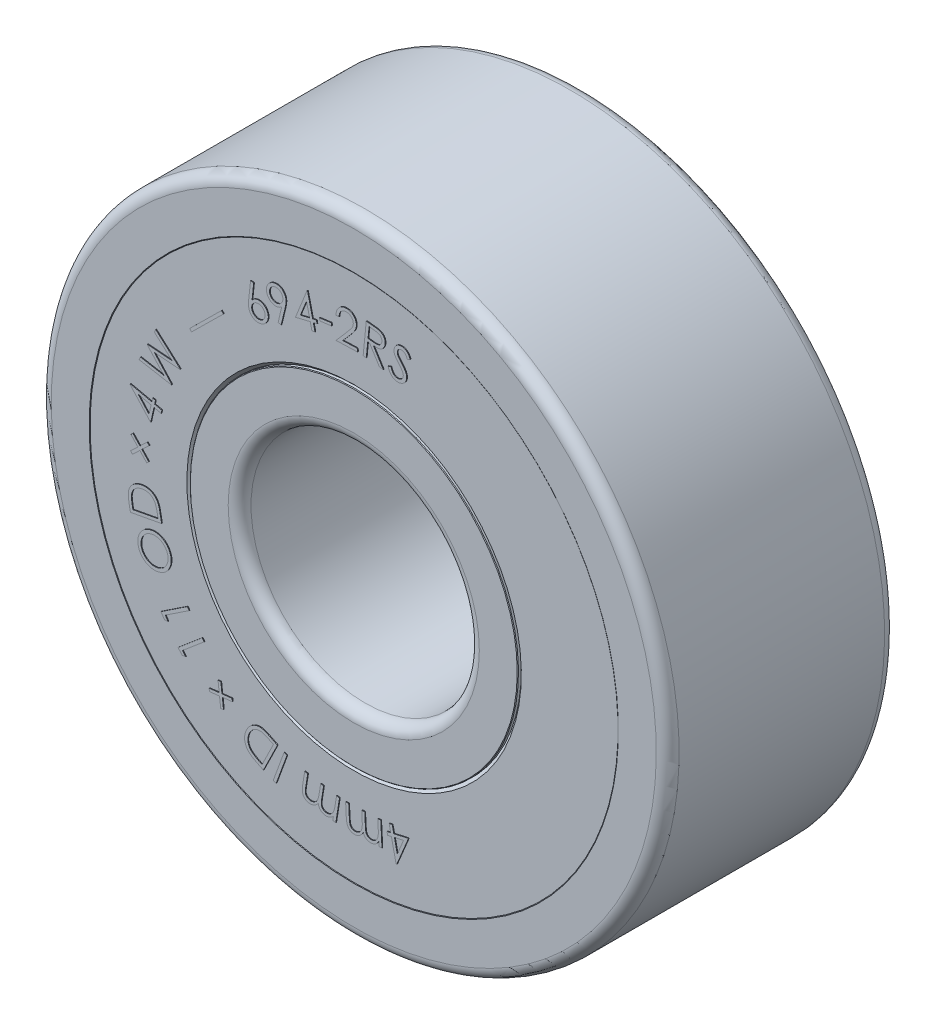
from build123d import *

# Parameters (mm, degrees)
SKETCH_R_INNER_BODY_W           = 4
SKETCH_R_INNER_BODY_H           = 0.875
FILLET_INNER_BODY_R             = 0.2
CHAMFER_INNER_BODY_SIZE         = 0.011
SKETCH_R_OUTER_BODY_W           = 4
SKETCH_R_OUTER_BODY_H           = 0.875
FILLET_OUTER_BODY_R             = 0.2
CHAMFER_OUTER_BODY_SIZE         = 0.011
SKETCH_R_SEAL_FACES_W           = 3.989
SKETCH_R_SEAL_FACES_H           = 1.75
CHAMFER_SEALS_SIZE              = 0.055
BOSS_EXTRUDE_SEAL_LABEL_1_DEPTH = 0.013
BOSS_EXTRUDE_SEAL_LABEL_2_DEPTH = 0.013


with BuildPart() as part:
    # Sketch R, INNER BODY → Revolve INNER BODY (revolve)
    with BuildSketch(Plane(origin=(0, 0, 0), x_dir=(0, 0, -1), z_dir=(1, 0, 0))):
        with Locations((0, 2.4375)):
            Rectangle(SKETCH_R_INNER_BODY_W, SKETCH_R_INNER_BODY_H)
    revolve(axis=Axis((0, 0, 3.81), (0, 0, -1)))

    # Fillet INNER BODY
    fillet_inner_body_edges = [part.edges().sort_by_distance(p)[0] for p in [
        (0, -2, 2),
        (0, -2, -2),
    ]]
    fillet(fillet_inner_body_edges, radius=FILLET_INNER_BODY_R)

    # Chamfer INNER BODY
    chamfer_inner_body_edges = [part.edges().sort_by_distance(p)[0] for p in [
        (0, -2.875, -2),
        (0, -2.875, 2),
    ]]
    chamfer(chamfer_inner_body_edges, length=CHAMFER_INNER_BODY_SIZE)



with BuildPart() as body_2:
    # Sketch R, OUTER BODY → Revolve OUTER BODY (revolve)
    with BuildSketch(Plane(origin=(0, 0, 0), x_dir=(0, 0, -1), z_dir=(1, 0, 0))):
        with Locations((0, 5.0625)):
            Rectangle(SKETCH_R_OUTER_BODY_W, SKETCH_R_OUTER_BODY_H)
    revolve(axis=Axis((0, 0, 3.81), (0, 0, -1)))

    # Fillet OUTER BODY
    fillet_outer_body_edges = [body_2.edges().sort_by_distance(p)[0] for p in [
        (0, -5.5, 2),
        (0, -5.5, -2),
    ]]
    fillet(fillet_outer_body_edges, radius=FILLET_OUTER_BODY_R)

    # Chamfer OUTER BODY
    chamfer_outer_body_edges = [body_2.edges().sort_by_distance(p)[0] for p in [
        (0, -4.625, 2),
        (0, -4.625, -2),
    ]]
    chamfer(chamfer_outer_body_edges, length=CHAMFER_OUTER_BODY_SIZE)


with BuildPart() as body_3:
    # Sketch R, SEAL FACES → Revolve SEALS (revolve)
    with BuildSketch(Plane(origin=(0, 0, 0), x_dir=(0, 0, -1), z_dir=(1, 0, 0))):
        with Locations((0, 3.75)):
            Rectangle(SKETCH_R_SEAL_FACES_W, SKETCH_R_SEAL_FACES_H)
    revolve(axis=Axis((0, 0, 3.81), (0, 0, -1)))

    # Chamfer SEALS
    chamfer_seals_edges = [body_3.edges().sort_by_distance(p)[0] for p in [
        (0, -2.875, -1.9945),
        (0, -2.875, 1.9945),
    ]]
    chamfer(chamfer_seals_edges, length=CHAMFER_SEALS_SIZE)


with BuildPart() as part_1:
    add(part.part)

    add(body_3.part)  # Boss-Extrude SEAL LABEL 1 merges body 3

    add(body_2.part)  # Boss-Extrude SEAL LABEL 1 merges body 2
    # Sketch TEXT RADIUS 1 — MANUALLY ASSIGN TEXT AND FONT SIZE (FROM EQUATIONS) → Boss-Extrude SEAL LABEL 1 (add)
    # profile 1 of 21: a face of its own
    with BuildSketch(Plane.XY.offset(1.9945)):
        with BuildLine():
            Line((0.607723769, 3.520639161), (0.65988723, 3.537802623))
            add(Edge.make_bspline(
                [(0.65988723, 3.537802623), (0.662286596, 3.529825366), (0.666869537, 3.514588298), (0.675714221, 3.493467812), (0.685452275, 3.47493106), (0.696552006, 3.459184631), (0.708563687, 3.445874642), (0.721951956, 3.435482171), (0.736386371, 3.427506782), (0.746788524, 3.424605159), (0.751986589, 3.423155187)],
                knots=[0, 0, 0, 0, 1.293624657, 2.47090539, 3.552330697, 4.540529379, 5.457490369, 6.326881561, 7.163925064, 8, 8, 8, 8], degree=3))
            add(Edge.make_bspline(
                [(0.751986589, 3.423155187), (0.756495756, 3.422289641), (0.765420789, 3.420576459), (0.779044032, 3.420082671), (0.792601324, 3.421209109), (0.805945881, 3.423981902), (0.818671078, 3.428340372), (0.830468935, 3.434031326), (0.840997346, 3.441287084), (0.850216957, 3.449887293), (0.858163981, 3.459456589), (0.864561778, 3.469876349), (0.869686137, 3.480882652), (0.871758191, 3.488666171), (0.872803897, 3.49259429)],
                knots=[0, 0, 0, 0, 1.065263985, 2.108486134, 3.154416784, 4.219114026, 5.265657628, 6.271770253, 7.252363297, 8.223485526, 9.192157436, 10.132211779, 11.05738092, 12, 12, 12, 12], degree=3))
            add(Edge.make_bspline(
                [(0.872803897, 3.49259429), (0.873594062, 3.497179446), (0.87519263, 3.506455597), (0.874737221, 3.520886466), (0.871889895, 3.535631511), (0.868345946, 3.545211478), (0.866521845, 3.550142366)],
                knots=[0, 0, 0, 0, 0.947869012, 1.917617609, 2.928180434, 4, 4, 4, 4], degree=3))
            add(Edge.make_bspline(
                [(0.866521845, 3.550142366), (0.864917614, 3.553751755), (0.861526178, 3.561382207), (0.855343206, 3.572937158), (0.847946106, 3.585249745), (0.839468127, 3.598346373), (0.829596088, 3.612150686), (0.818707251, 3.626822857), (0.806350695, 3.642067965), (0.797728949, 3.652459036), (0.79326864, 3.657834674)],
                knots=[0, 0, 0, 0, 0.725150294, 1.533008948, 2.404465008, 3.36249444, 4.397030047, 5.520432249, 6.717239159, 8, 8, 8, 8], degree=3))
            add(Edge.make_bspline(
                [(0.79326864, 3.657834674), (0.788791033, 3.663121611), (0.780221961, 3.673239547), (0.768405974, 3.688067049), (0.757807096, 3.701525732), (0.74859191, 3.713718139), (0.740807091, 3.724693415), (0.734518042, 3.734481898), (0.729472106, 3.742967551), (0.726899534, 3.748383267), (0.725736589, 3.750831469)],
                knots=[0, 0, 0, 0, 1.44321755, 2.761974075, 3.949401875, 5.011932278, 5.94557205, 6.751543883, 7.435628837, 8, 8, 8, 8], degree=3))
            add(Edge.make_bspline(
                [(0.725736589, 3.750831469), (0.724145287, 3.754547834), (0.721022099, 3.761841804), (0.717385721, 3.77305765), (0.714876203, 3.784304242), (0.71300489, 3.795492989), (0.712210458, 3.806686007), (0.712484762, 3.817864358), (0.713543215, 3.829055011), (0.715015845, 3.836434377), (0.715752615, 3.840126341)],
                knots=[0, 0, 0, 0, 1.060382417, 2.081172537, 3.087909626, 4.081509464, 5.055244106, 6.026751934, 7.012766187, 8, 8, 8, 8], degree=3))
            add(Edge.make_bspline(
                [(0.715752615, 3.840126341), (0.717237205, 3.845863801), (0.720166879, 3.857186037), (0.727294748, 3.873043858), (0.736079699, 3.887745273), (0.74689111, 3.900959329), (0.759324254, 3.912637677), (0.773276642, 3.92251886), (0.788615967, 3.930396119), (0.805164053, 3.936169413), (0.822407522, 3.940036584), (0.840095348, 3.941405523), (0.857977606, 3.940867661), (0.86975738, 3.938630591), (0.875720563, 3.937498136)],
                knots=[0, 0, 0, 0, 1.019685274, 2.012234592, 2.983640926, 3.963876957, 4.944049445, 5.914878534, 6.900521873, 7.905295576, 8.927847738, 9.936580993, 10.955451496, 12, 12, 12, 12], degree=3))
            add(Edge.make_bspline(
                [(0.875720563, 3.937498136), (0.881947077, 3.935874909), (0.894354392, 3.932640374), (0.911869361, 3.924759351), (0.928216516, 3.914722546), (0.940967008, 3.904688974), (0.950410256, 3.895099156), (0.95768573, 3.887061088), (0.964550936, 3.877742126), (0.971559527, 3.867601624), (0.978215829, 3.856274932), (0.985031803, 3.844083719), (0.991429125, 3.8307038), (0.995620442, 3.821437316), (0.997771845, 3.816680828)],
                knots=[0, 0, 0, 0, 1.29133387, 2.573187033, 3.841376567, 5.140558177, 5.820715133, 6.544631108, 7.317152607, 8.14462792, 9.020990099, 9.955994548, 10.95081152, 12, 12, 12, 12], degree=3))
            Line((0.997771845, 3.816680828), (0.946057102, 3.793235315))
            add(Edge.make_bspline(
                [(0.946057102, 3.793235315), (0.94433441, 3.797066129), (0.941013364, 3.804451266), (0.935656903, 3.814847903), (0.930658043, 3.824452178), (0.925658927, 3.833098893), (0.920555381, 3.84068986), (0.91576857, 3.847513077), (0.910982262, 3.853341155), (0.904682769, 3.859770907), (0.896465392, 3.866555696), (0.88580851, 3.873245832), (0.87428854, 3.878547293), (0.866076745, 3.880670715), (0.861922487, 3.881744931)],
                knots=[0, 0, 0, 0, 1.187206707, 2.288725883, 3.305414615, 4.248193694, 5.110169964, 5.890495012, 6.603784738, 7.239190464, 8.432967784, 9.606161192, 10.788982959, 12, 12, 12, 12], degree=3))
            add(Edge.make_bspline(
                [(0.861922487, 3.881744931), (0.856632272, 3.882679662), (0.846433347, 3.884481717), (0.831171706, 3.884069225), (0.816854416, 3.880639785), (0.80378979, 3.874437022), (0.792265557, 3.866091571), (0.783043659, 3.85563122), (0.775875583, 3.843526662), (0.773429955, 3.834449327), (0.772178897, 3.829805828)],
                knots=[0, 0, 0, 0, 1.110447401, 2.14081492, 3.136254554, 4.137370533, 5.117757228, 6.061145359, 7.008181256, 8, 8, 8, 8], degree=3))
            add(Edge.make_bspline(
                [(0.772178897, 3.829805828), (0.771581713, 3.826861949), (0.770387901, 3.820976937), (0.769920516, 3.811934046), (0.77021378, 3.802838731), (0.771577286, 3.793564657), (0.774251588, 3.78392535), (0.778381353, 3.773754227), (0.783765657, 3.762809187), (0.78823113, 3.755544313), (0.790576333, 3.751728905)],
                knots=[0, 0, 0, 0, 0.871820197, 1.742827382, 2.623608217, 3.513392156, 4.459766513, 5.523174493, 6.699206774, 8, 8, 8, 8], degree=3))
            add(Edge.make_bspline(
                [(0.790576333, 3.751728905), (0.791459661, 3.750409966), (0.793575269, 3.747251053), (0.797683898, 3.742052918), (0.802965659, 3.735375425), (0.809587246, 3.727398282), (0.817300269, 3.717858848), (0.826575762, 3.707179109), (0.836946273, 3.694936265), (0.84434073, 3.686359733), (0.848236589, 3.681841084)],
                knots=[0, 0, 0, 0, 0.420203778, 1.006405523, 1.753299967, 2.674995281, 3.751353208, 5.001460402, 6.420183275, 8, 8, 8, 8], degree=3))
            add(Edge.make_bspline(
                [(0.848236589, 3.681841084), (0.852946708, 3.676336739), (0.862069118, 3.665676096), (0.874736585, 3.649697209), (0.886207477, 3.634479867), (0.896384116, 3.619891578), (0.905066716, 3.605861579), (0.912726404, 3.592626856), (0.918844513, 3.57995185), (0.923909842, 3.567956244), (0.927730822, 3.556336678), (0.930792268, 3.544993184), (0.933026235, 3.533786123), (0.934527819, 3.522775683), (0.935119514, 3.511928931), (0.93469688, 3.501289286), (0.933809137, 3.490764164), (0.932402106, 3.483908828), (0.931698128, 3.480478905)],
                knots=[0, 0, 0, 0, 1.536073138, 2.975017644, 4.322978621, 5.57669241, 6.744976084, 7.820922578, 8.817416066, 9.727443028, 10.579968404, 11.408937766, 12.217558863, 13.001425802, 13.763659041, 14.517306851, 15.258165781, 16, 16, 16, 16], degree=3))
            add(Edge.make_bspline(
                [(0.931698128, 3.480478905), (0.930498259, 3.475659011), (0.928133089, 3.466158082), (0.922715029, 3.452578092), (0.916134949, 3.439779873), (0.908197359, 3.427812937), (0.899066415, 3.416612252), (0.888560888, 3.406297556), (0.876825796, 3.396695232), (0.863914615, 3.388074594), (0.850296147, 3.380473002), (0.836154015, 3.374386919), (0.821747095, 3.369702964), (0.806946082, 3.366749515), (0.791896049, 3.36497377), (0.776527931, 3.36495579), (0.760880963, 3.366200644), (0.750511365, 3.368337968), (0.74525582, 3.369421213)],
                knots=[0, 0, 0, 0, 0.988260705, 1.948050048, 2.904017821, 3.850041754, 4.802667632, 5.776910546, 6.777220255, 7.818257963, 8.86495432, 9.879030912, 10.880005757, 11.876120462, 12.880303923, 13.893176537, 14.932214427, 16, 16, 16, 16], degree=3))
            add(Edge.make_bspline(
                [(0.74525582, 3.369421213), (0.741199173, 3.370403996), (0.733187193, 3.372345019), (0.721549144, 3.376362949), (0.710379228, 3.381040925), (0.699638026, 3.386445573), (0.689410737, 3.392646804), (0.679617954, 3.399571728), (0.670440524, 3.407432215), (0.661448902, 3.415792233), (0.653149432, 3.425317505), (0.645305037, 3.435818613), (0.637726578, 3.447250233), (0.630809317, 3.45989763), (0.624324148, 3.473581899), (0.618286926, 3.488306674), (0.612633612, 3.504055253), (0.609389524, 3.515012763), (0.607723769, 3.520639161)],
                knots=[0, 0, 0, 0, 0.927220515, 1.831284199, 2.732670077, 3.617233609, 4.500898769, 5.388735586, 6.279368502, 7.184653688, 8.114997418, 9.082354606, 10.096556312, 11.16044507, 12.283086015, 13.460644949, 14.696106911, 16, 16, 16, 16], degree=3))
        make_face()
    # profile 2 of 21: a face of its own
    with BuildSketch(Plane.XY.offset(1.9945)):
        with BuildLine():
            Line((0.226206165, 4.013467799), (0.336142062, 4.002698568))
            add(Edge.make_bspline(
                [(0.336142062, 4.002698568), (0.343473037, 4.001969986), (0.357547189, 4.00057124), (0.377711134, 3.998258342), (0.395974943, 3.995700742), (0.412433357, 3.993493261), (0.426949135, 3.990817353), (0.43965916, 3.988435867), (0.45046856, 3.985938215), (0.456932173, 3.983888517), (0.459876036, 3.982954978)],
                knots=[0, 0, 0, 0, 1.408978601, 2.704985143, 3.881254339, 4.9361233, 5.880260789, 6.703556981, 7.409532968, 8, 8, 8, 8], degree=3))
            add(Edge.make_bspline(
                [(0.459876036, 3.982954978), (0.463787963, 3.981555654), (0.471544652, 3.978781031), (0.482638044, 3.973637245), (0.493000946, 3.967600572), (0.502821321, 3.961021837), (0.511904155, 3.953579073), (0.52037582, 3.94543655), (0.528264606, 3.936609132), (0.53527104, 3.92693609), (0.541583843, 3.916780277), (0.546873038, 3.906071465), (0.551132943, 3.894949393), (0.554419346, 3.883392422), (0.55669105, 3.871379675), (0.557710447, 3.858907519), (0.558021596, 3.846007383), (0.557361078, 3.837306198), (0.557023472, 3.832858825)],
                knots=[0, 0, 0, 0, 1.026905356, 2.036179405, 3.017803908, 3.989670773, 4.955671142, 5.916881396, 6.892741861, 7.878363789, 8.866237975, 9.846162995, 10.826567655, 11.806972315, 12.813362717, 13.843758133, 14.897895753, 16, 16, 16, 16], degree=3))
            add(Edge.make_bspline(
                [(0.557023472, 3.832858825), (0.556057165, 3.82560468), (0.554168015, 3.811422675), (0.548117875, 3.7911295), (0.539559713, 3.772460118), (0.528499386, 3.755504316), (0.515131638, 3.740539894), (0.499562593, 3.727772932), (0.481817026, 3.717569508), (0.465600676, 3.710901853), (0.451444714, 3.706905061), (0.439817362, 3.704504036), (0.427324247, 3.702524072), (0.413935547, 3.701508937), (0.399679199, 3.700945046), (0.384522065, 3.700945749), (0.368465911, 3.70161647), (0.35749046, 3.702574543), (0.35184719, 3.703067158)],
                knots=[0, 0, 0, 0, 1.271156562, 2.485137636, 3.666475366, 4.831647523, 5.99220123, 7.142929715, 8.317374305, 9.539462158, 10.181708886, 10.872982128, 11.603226247, 12.379805019, 13.206319685, 14.084218157, 15.014958436, 16, 16, 16, 16], degree=3))
            Line((0.35184719, 3.703067158), (0.525164498, 3.42699344))
            Line((0.525164498, 3.42699344), (0.45684719, 3.433724209))
            Line((0.45684719, 3.433724209), (0.2839786, 3.709685748))
            Line((0.2839786, 3.709685748), (0.252456165, 3.712826773))
            Line((0.252456165, 3.712826773), (0.227327959, 3.456272286))
            Line((0.227327959, 3.456272286), (0.172135652, 3.461656902))
            Line((0.172135652, 3.461656902), (0.226206165, 4.013467799))
        make_face()
        with BuildLine():
            Line((0.276126036, 3.954012671), (0.2577286, 3.766448568))
            Line((0.2577286, 3.766448568), (0.352520267, 3.756464594))
            add(Edge.make_bspline(
                [(0.352520267, 3.756464594), (0.356968756, 3.756077685), (0.365560315, 3.755330433), (0.378047762, 3.754456871), (0.389689041, 3.754291437), (0.400462193, 3.754383338), (0.410348559, 3.754782039), (0.419375717, 3.755676357), (0.427556731, 3.756976219), (0.437207777, 3.759357281), (0.448212203, 3.763396545), (0.460233499, 3.76988203), (0.470821257, 3.778256263), (0.480015774, 3.788125569), (0.4876423, 3.7993387), (0.493480729, 3.811611308), (0.497796093, 3.824683807), (0.498985815, 3.833837746), (0.499587575, 3.838467799)],
                knots=[0, 0, 0, 0, 1.116566739, 2.156473847, 3.129049351, 4.026694091, 4.850340023, 5.602067406, 6.293774804, 6.919663588, 8.085150109, 9.214909928, 10.320342393, 11.444983482, 12.57567149, 13.69641919, 14.834851067, 16, 16, 16, 16], degree=3))
            add(Edge.make_bspline(
                [(0.499587575, 3.838467799), (0.499820349, 3.843029067), (0.50027956, 3.852027405), (0.498867924, 3.865427449), (0.495093958, 3.878249992), (0.489811741, 3.890530585), (0.482756324, 3.901821976), (0.474307696, 3.911788283), (0.464479638, 3.920246177), (0.455131369, 3.926014522), (0.446640497, 3.929876378), (0.439184786, 3.932513659), (0.430775426, 3.935101747), (0.421312646, 3.937480212), (0.410762583, 3.939404758), (0.399206306, 3.941307104), (0.386617814, 3.943170991), (0.377840117, 3.944030336), (0.373273472, 3.944477414)],
                knots=[0, 0, 0, 0, 1.164715721, 2.29771744, 3.418595094, 4.564029961, 5.700122658, 6.803637819, 7.886446823, 8.996258547, 9.594186248, 10.264441733, 11.013141311, 11.839507612, 12.752940364, 13.749268155, 14.829044546, 16, 16, 16, 16], degree=3))
            Line((0.373273472, 3.944477414), (0.276126036, 3.954012671))
        make_face(mode=Mode.SUBTRACT)
    # profile 3 of 21: a face of its own
    with BuildSketch(Plane.XY.offset(1.9945)):
        with BuildLine():
            Line((-0.250406738, 3.839972449), (-0.303804174, 3.838177577))
            add(Edge.make_bspline(
                [(-0.303804174, 3.838177577), (-0.303705044, 3.844915587), (-0.303509995, 3.858173488), (-0.301079848, 3.87758134), (-0.297160547, 3.896129277), (-0.291666169, 3.913793586), (-0.28456312, 3.93064526), (-0.275808074, 3.9465872), (-0.265373869, 3.961643539), (-0.253430151, 3.975662214), (-0.240306745, 3.988496478), (-0.226195763, 3.99978034), (-0.211298405, 4.009504258), (-0.19558358, 4.017641307), (-0.178918306, 4.023928084), (-0.16148163, 4.02860704), (-0.143237209, 4.031857336), (-0.130762001, 4.032562966), (-0.124429174, 4.032921167)],
                knots=[0, 0, 0, 0, 1.09610111, 2.156720024, 3.177312475, 4.178281426, 5.162833821, 6.14885236, 7.133084921, 8.13912911, 9.141928106, 10.116174728, 11.074996441, 12.033122543, 12.990494497, 13.967853736, 14.968415556, 16, 16, 16, 16], degree=3))
            add(Edge.make_bspline(
                [(-0.124429174, 4.032921167), (-0.118179625, 4.033012927), (-0.105912729, 4.033193037), (-0.087938335, 4.0312607), (-0.070767895, 4.028129466), (-0.054508865, 4.023107303), (-0.039073139, 4.016613894), (-0.024518356, 4.008481088), (-0.010863923, 3.99877759), (0.001723861, 3.987564524), (0.01317066, 3.975325083), (0.023331095, 3.962388842), (0.032041893, 3.948848179), (0.039269552, 3.934695714), (0.044865397, 3.919845481), (0.049184523, 3.904473756), (0.051871942, 3.888443949), (0.052572262, 3.877561748), (0.052926595, 3.872055782)],
                knots=[0, 0, 0, 0, 1.121068529, 2.200483838, 3.239244094, 4.250015204, 5.248699098, 6.240409869, 7.236925556, 8.249856602, 9.261452149, 10.2417373, 11.198856243, 12.147533922, 13.088796311, 14.043180623, 15.009926392, 16, 16, 16, 16], degree=3))
            add(Edge.make_bspline(
                [(0.052926595, 3.872055782), (0.052901025, 3.864265968), (0.052850219, 3.848788656), (0.049252206, 3.825847324), (0.04279912, 3.803593328), (0.035028368, 3.785530557), (0.027074869, 3.770929454), (0.019747647, 3.758930812), (0.011098193, 3.745977128), (0.001221782, 3.732033133), (-0.010091817, 3.717215001), (-0.022603164, 3.701344791), (-0.036403063, 3.684481942), (-0.046213829, 3.673101978), (-0.051288148, 3.667216039)],
                knots=[0, 0, 0, 0, 1.187636333, 2.359673348, 3.530152911, 4.716485695, 5.352369705, 6.066914481, 6.861558154, 7.729385722, 8.674544837, 9.706751176, 10.813886903, 12, 12, 12, 12], degree=3))
            Line((-0.051288148, 3.667216039), (-0.184893917, 3.513081423))
            Line((-0.184893917, 3.513081423), (0.072221467, 3.521607064))
            Line((0.072221467, 3.521607064), (0.074016339, 3.46787309))
            Line((0.074016339, 3.46787309), (-0.304252892, 3.455308987))
            Line((-0.304252892, 3.455308987), (-0.09907661, 3.692232064))
            add(Edge.make_bspline(
                [(-0.09907661, 3.692232064), (-0.094083556, 3.697973735), (-0.08450977, 3.708982936), (-0.071030482, 3.725112502), (-0.058782754, 3.73995726), (-0.047973218, 3.753734227), (-0.038714874, 3.766471015), (-0.030535787, 3.777835247), (-0.023938866, 3.78817185), (-0.016872086, 3.800179804), (-0.010132882, 3.814745936), (-0.004619968, 3.832547081), (-0.001260313, 3.850687161), (-0.001257501, 3.862917923), (-0.001256097, 3.869026936)],
                knots=[0, 0, 0, 0, 1.322249771, 2.535309726, 3.652720278, 4.666612977, 5.577693518, 6.388995066, 7.099194273, 7.707731152, 8.809673554, 9.878410297, 10.940309751, 12, 12, 12, 12], degree=3))
            add(Edge.make_bspline(
                [(-0.001256097, 3.869026936), (-0.001473879, 3.872886643), (-0.001903779, 3.880505664), (-0.003949011, 3.891646895), (-0.00716349, 3.902289368), (-0.011274535, 3.912557292), (-0.016621933, 3.922323678), (-0.022881646, 3.931711501), (-0.030427466, 3.940493013), (-0.038829375, 3.948836327), (-0.048082154, 3.956349839), (-0.057755212, 3.963098437), (-0.06798312, 3.968562577), (-0.078654549, 3.972989067), (-0.089769671, 3.976380758), (-0.101394011, 3.978567025), (-0.113442132, 3.979888891), (-0.121621345, 3.979795514), (-0.125775328, 3.97974809)],
                knots=[0, 0, 0, 0, 1.000666622, 1.975305374, 2.925327445, 3.876829686, 4.834621621, 5.804435398, 6.794119077, 7.82835027, 8.867649035, 9.877833588, 10.878922027, 11.864663768, 12.866642126, 13.882937842, 14.924806176, 16, 16, 16, 16], degree=3))
            add(Edge.make_bspline(
                [(-0.125775328, 3.97974809), (-0.130119233, 3.979482347), (-0.138661489, 3.978959766), (-0.151198542, 3.976970371), (-0.163081599, 3.973668714), (-0.174423627, 3.96942053), (-0.185089871, 3.96396219), (-0.195306005, 3.957608886), (-0.20469526, 3.949857574), (-0.213597602, 3.941261627), (-0.221632431, 3.931629549), (-0.228776537, 3.921129102), (-0.234818684, 3.909699661), (-0.240013208, 3.897442277), (-0.244128897, 3.884284768), (-0.247273194, 3.870291198), (-0.249395471, 3.855432436), (-0.250063895, 3.845213749), (-0.250406738, 3.839972449)],
                knots=[0, 0, 0, 0, 1.001933367, 1.970293815, 2.916655522, 3.837882293, 4.754468703, 5.671863819, 6.60254096, 7.55253945, 8.518407825, 9.485733883, 10.472001752, 11.490816228, 12.5475395, 13.642247531, 14.790677614, 16, 16, 16, 16], degree=3))
        make_face()
    # profile 4 of 21: a face of its own
    with BuildSketch(Plane.XY.offset(1.9945)):
        Polygon((-0.591304953, 3.653905547), (-0.385006876, 3.681389521), (-0.378837004, 3.635620291), (-0.585135081, 3.608136316), align=None)
    # profile 5 of 21: a face of its own
    with BuildSketch(Plane.XY.offset(1.9945)):
        Polygon((-0.813115456, 3.952835148), (-0.802009687, 3.955527455), (-0.712826995, 3.57826784), (-0.647314174, 3.593748609), (-0.634974431, 3.541809506), (-0.700487251, 3.526328737), (-0.670759687, 3.400463353), (-0.72494238, 3.387674891), (-0.754669944, 3.513540276), (-1.013355841, 3.452290276), align=None)
        Polygon((-0.767009687, 3.565479378), (-0.820294944, 3.791072327), (-0.926304559, 3.527787071), align=None, mode=Mode.SUBTRACT)
    # profile 6 of 21: a face of its own
    with BuildSketch(Plane.XY.offset(1.9945)):
        with BuildLine():
            Line((-1.264076418, 3.210092289), (-1.317025136, 3.221758956))
            Line((-1.317025136, 3.221758956), (-1.255662957, 3.487175622))
            add(Edge.make_bspline(
                [(-1.255662957, 3.487175622), (-1.259765387, 3.484040198), (-1.267768853, 3.477923271), (-1.280316674, 3.470109128), (-1.29273014, 3.463341589), (-1.301283622, 3.459912092), (-1.305470649, 3.458233315)],
                knots=[0, 0, 0, 0, 1.070877017, 2.089182993, 3.064633274, 4, 4, 4, 4], degree=3))
            add(Edge.make_bspline(
                [(-1.305470649, 3.458233315), (-1.310601493, 3.456488764), (-1.320700288, 3.453055048), (-1.336151717, 3.449680494), (-1.351529512, 3.447999554), (-1.36687352, 3.447843755), (-1.382172642, 3.449462153), (-1.397390379, 3.452622619), (-1.412542037, 3.45737476), (-1.427393883, 3.463736466), (-1.441731175, 3.471423544), (-1.455053408, 3.48038949), (-1.467326646, 3.490470858), (-1.478437432, 3.501720889), (-1.48851357, 3.514132532), (-1.497310056, 3.527758747), (-1.505203172, 3.542424169), (-1.509329855, 3.552865776), (-1.511432187, 3.558185238)],
                knots=[0, 0, 0, 0, 1.019113924, 2.005873008, 2.968558696, 3.925467701, 4.887407469, 5.857469773, 6.84550732, 7.870071413, 8.893184967, 9.902071, 10.886720765, 11.876785416, 12.872334957, 13.889065895, 14.924587691, 16, 16, 16, 16], degree=3))
            add(Edge.make_bspline(
                [(-1.511432187, 3.558185238), (-1.513919796, 3.565609453), (-1.518809212, 3.58020181), (-1.5225007, 3.602727916), (-1.523550343, 3.625052092), (-1.521212975, 3.647093553), (-1.516079814, 3.668619948), (-1.50793118, 3.68925944), (-1.496916631, 3.708884445), (-1.483129561, 3.727125221), (-1.467197458, 3.743776915), (-1.449389622, 3.758255861), (-1.42979311, 3.77023529), (-1.415680907, 3.776105887), (-1.408563598, 3.779066648)],
                knots=[0, 0, 0, 0, 1.036941894, 2.038118013, 3.01588058, 3.992926031, 4.967211337, 5.942455386, 6.926048581, 7.942679323, 8.966841883, 9.975250693, 10.978843501, 12, 12, 12, 12], degree=3))
            add(Edge.make_bspline(
                [(-1.408563598, 3.779066648), (-1.401401959, 3.78148604), (-1.387228026, 3.78627437), (-1.365126537, 3.789678459), (-1.342966126, 3.790602826), (-1.320869148, 3.788252879), (-1.299269128, 3.783297615), (-1.278610789, 3.775394561), (-1.259314313, 3.76446723), (-1.241403867, 3.751002678), (-1.225284046, 3.735401392), (-1.211145697, 3.718109074), (-1.199596912, 3.699040183), (-1.193906035, 3.685328747), (-1.191047572, 3.678441648)],
                knots=[0, 0, 0, 0, 1.018443567, 2.015649199, 3.005369851, 4.004616377, 5.004690828, 5.988721566, 6.978339292, 7.987614859, 9.004744829, 9.998573822, 10.99470631, 12, 12, 12, 12], degree=3))
            add(Edge.make_bspline(
                [(-1.191047572, 3.678441648), (-1.189183567, 3.672938538), (-1.185402999, 3.661777147), (-1.181627896, 3.644103187), (-1.17946604, 3.625478232), (-1.178767857, 3.60926756), (-1.179129395, 3.59564803), (-1.179643247, 3.584603924), (-1.180768681, 3.572886959), (-1.182555553, 3.560492291), (-1.184484553, 3.547374755), (-1.187135513, 3.533590585), (-1.190141821, 3.51911206), (-1.192446646, 3.50927016), (-1.1936277, 3.504226904)],
                knots=[0, 0, 0, 0, 1.181802668, 2.396928625, 3.669425894, 4.99474283, 5.695084178, 6.441893855, 7.244623594, 8.089538179, 8.990455433, 9.942785481, 10.94582779, 12, 12, 12, 12], degree=3))
            Line((-1.1936277, 3.504226904), (-1.264076418, 3.210092289))
        make_face()
        with BuildLine():
            add(Edge.make_bspline(
                [(-1.310406546, 3.508489725), (-1.306713583, 3.509997428), (-1.29941028, 3.512979102), (-1.289103591, 3.518478152), (-1.279572462, 3.524797103), (-1.270891107, 3.532023417), (-1.26301959, 3.540099345), (-1.25602599, 3.549097111), (-1.249715178, 3.558818891), (-1.244425974, 3.569355439), (-1.239894756, 3.580227267), (-1.236668555, 3.591377857), (-1.234513909, 3.602529163), (-1.233454701, 3.613729177), (-1.233721846, 3.624972668), (-1.235079871, 3.636239654), (-1.23754068, 3.647557101), (-1.240035352, 3.65494238), (-1.241303982, 3.658698058)],
                knots=[0, 0, 0, 0, 1.040144916, 2.05701784, 3.041893774, 4.01866759, 4.998311485, 5.978003954, 6.987361779, 8.017023135, 9.049637989, 10.056021345, 11.039446728, 12.009229004, 12.984979229, 13.967533252, 14.966417868, 16, 16, 16, 16], degree=3))
            add(Edge.make_bspline(
                [(-1.241303982, 3.658698058), (-1.242769717, 3.662354792), (-1.245673971, 3.669600364), (-1.251156295, 3.679825383), (-1.257675281, 3.689129199), (-1.264669021, 3.697923549), (-1.27285163, 3.705623981), (-1.281790951, 3.712637747), (-1.291523254, 3.718938531), (-1.302056896, 3.724230507), (-1.312929508, 3.728760964), (-1.324079889, 3.731987417), (-1.335231267, 3.734141803), (-1.346431195, 3.735201794), (-1.357712158, 3.734930864), (-1.369050879, 3.733569664), (-1.38050171, 3.731139687), (-1.387946466, 3.728555409), (-1.391736675, 3.727239725)],
                knots=[0, 0, 0, 0, 1.027701881, 2.036322089, 3.018923813, 3.989825159, 4.963028906, 5.943058814, 6.952764296, 7.982780303, 9.015750826, 10.022480815, 11.006244923, 11.976361226, 12.952447532, 13.945030059, 14.953791891, 16, 16, 16, 16], degree=3))
            add(Edge.make_bspline(
                [(-1.391736675, 3.727239725), (-1.395391992, 3.725731377), (-1.402621407, 3.722748196), (-1.41282419, 3.717257376), (-1.422239602, 3.710890302), (-1.430929565, 3.703754693), (-1.438650288, 3.69554559), (-1.4458243, 3.686716395), (-1.45192672, 3.676835325), (-1.457419532, 3.666414392), (-1.461876798, 3.655526234), (-1.465159698, 3.644433571), (-1.467288904, 3.63331114), (-1.468353019, 3.622112808), (-1.468084556, 3.610868865), (-1.466726888, 3.599602001), (-1.464265983, 3.588284522), (-1.461771324, 3.580899248), (-1.4605027, 3.577143571)],
                knots=[0, 0, 0, 0, 1.033544123, 2.044123449, 3.023131612, 4.002139776, 4.977233848, 5.965233959, 6.971642021, 8.008142036, 9.043118974, 10.042424628, 11.028099574, 12.000100206, 12.978082437, 13.96288403, 14.964053572, 16, 16, 16, 16], degree=3))
            add(Edge.make_bspline(
                [(-1.4605027, 3.577143571), (-1.459037621, 3.573486294), (-1.456134664, 3.566239646), (-1.450642829, 3.556022518), (-1.444145217, 3.546670124), (-1.437022621, 3.537986573), (-1.428918541, 3.530192846), (-1.420086336, 3.523061734), (-1.41021215, 3.516950965), (-1.399788264, 3.51146506), (-1.388871523, 3.506975258), (-1.37772739, 3.503753813), (-1.36658153, 3.501536237), (-1.355370146, 3.500722318), (-1.344131108, 3.500741346), (-1.332867028, 3.502174382), (-1.321527975, 3.504587069), (-1.314159166, 3.507172881), (-1.310406546, 3.508489725)],
                knots=[0, 0, 0, 0, 1.029311299, 2.039511043, 3.023651557, 4.002291997, 4.969986594, 5.957615604, 6.963645651, 7.999756348, 9.03434454, 10.042651104, 11.027955823, 11.998755251, 12.976223549, 13.960655243, 14.961448737, 16, 16, 16, 16], degree=3))
        make_face(mode=Mode.SUBTRACT)
    # profile 7 of 21: a face of its own
    with BuildSketch(Plane.XY.offset(1.9945)):
        with BuildLine():
            Line((-1.800240945, 3.612305502), (-1.745721714, 3.606920887))
            Line((-1.745721714, 3.606920887), (-1.773878766, 3.334885631))
            add(Edge.make_bspline(
                [(-1.773878766, 3.334885631), (-1.770199033, 3.338577654), (-1.763049557, 3.34575101), (-1.751576075, 3.355192441), (-1.740094691, 3.363487289), (-1.732042861, 3.368011895), (-1.728109535, 3.370222169)],
                knots=[0, 0, 0, 0, 1.076845582, 2.092239366, 3.068057225, 4, 4, 4, 4], degree=3))
            add(Edge.make_bspline(
                [(-1.728109535, 3.370222169), (-1.723215372, 3.372598659), (-1.713573554, 3.377280498), (-1.698575257, 3.382567064), (-1.683419577, 3.386174), (-1.668158534, 3.3882385), (-1.652739865, 3.388526865), (-1.637207175, 3.387324717), (-1.621553879, 3.384329211), (-1.605933767, 3.379864837), (-1.590721111, 3.373983333), (-1.576246273, 3.366814016), (-1.562845243, 3.358195073), (-1.550302425, 3.348395046), (-1.53873193, 3.337293823), (-1.528246642, 3.324798314), (-1.518658301, 3.311097463), (-1.513162436, 3.301209359), (-1.51036915, 3.296183708)],
                knots=[0, 0, 0, 0, 1.01846668, 2.006445635, 2.971365139, 3.932208934, 4.884977731, 5.854588415, 6.845022103, 7.864812484, 8.893654223, 9.895977825, 10.884924524, 11.87270485, 12.87331403, 13.8821988, 14.923622676, 16, 16, 16, 16], degree=3))
            add(Edge.make_bspline(
                [(-1.51036915, 3.296183708), (-1.506946878, 3.289087149), (-1.500230778, 3.27516038), (-1.493816957, 3.253115581), (-1.490100009, 3.23093325), (-1.489550495, 3.208613462), (-1.492063021, 3.186514809), (-1.497391043, 3.16489895), (-1.506150634, 3.144076556), (-1.517520852, 3.124152974), (-1.531311334, 3.10553397), (-1.547547039, 3.08913208), (-1.565555696, 3.074549413), (-1.579049384, 3.067000415), (-1.585865945, 3.063186913)],
                knots=[0, 0, 0, 0, 1.037133709, 2.035341543, 3.014374921, 3.995714157, 4.968022127, 5.938891818, 6.920305346, 7.935951233, 8.957407097, 9.96488444, 10.971927484, 12, 12, 12, 12], degree=3))
            add(Edge.make_bspline(
                [(-1.585865945, 3.063186913), (-1.592667575, 3.059923964), (-1.606124872, 3.05346809), (-1.627559935, 3.047289093), (-1.649445049, 3.043730258), (-1.671658404, 3.043082218), (-1.693788867, 3.045251863), (-1.715298827, 3.050610737), (-1.735976662, 3.058874072), (-1.755577964, 3.069949539), (-1.773493263, 3.083661839), (-1.789730821, 3.099178614), (-1.803714111, 3.116817778), (-1.811101241, 3.129864635), (-1.814824279, 3.136440118)],
                knots=[0, 0, 0, 0, 1.013049736, 2.004359492, 2.987381555, 3.988591454, 4.984381154, 5.968675871, 6.959488023, 7.970613684, 8.986468017, 9.985857579, 10.984892801, 12, 12, 12, 12], degree=3))
            add(Edge.make_bspline(
                [(-1.814824279, 3.136440118), (-1.817328731, 3.141628609), (-1.822431474, 3.152199999), (-1.82812854, 3.169292511), (-1.832760225, 3.187467589), (-1.835411539, 3.20350075), (-1.836934619, 3.217111725), (-1.837536346, 3.228233312), (-1.837926268, 3.240091878), (-1.837701587, 3.252659227), (-1.837484783, 3.265982994), (-1.836479853, 3.280039348), (-1.835281227, 3.294851523), (-1.834215553, 3.304935665), (-1.833670432, 3.310093964)],
                knots=[0, 0, 0, 0, 1.168830002, 2.381454936, 3.650305335, 4.974735683, 5.677406892, 6.430493918, 7.235674995, 8.086125734, 8.982390139, 9.941035529, 10.946786629, 12, 12, 12, 12], degree=3))
            Line((-1.833670432, 3.310093964), (-1.800240945, 3.612305502))
        make_face()
        with BuildLine():
            add(Edge.make_bspline(
                [(-1.717340304, 3.320638836), (-1.720823078, 3.318726659), (-1.727691975, 3.31495537), (-1.737146604, 3.308153202), (-1.745700131, 3.300622166), (-1.75338675, 3.29234505), (-1.760299031, 3.283394878), (-1.76606763, 3.273522285), (-1.771221283, 3.263080703), (-1.775156479, 3.251910983), (-1.778169512, 3.240504839), (-1.780112005, 3.22905474), (-1.780938371, 3.217667718), (-1.780462676, 3.206350483), (-1.778865485, 3.195119636), (-1.776184424, 3.18398041), (-1.772241217, 3.172936398), (-1.7687866, 3.165838553), (-1.767035817, 3.1622414)],
                knots=[0, 0, 0, 0, 1.032004596, 2.03536968, 3.020154521, 3.989857835, 4.967710875, 5.952879386, 6.957091549, 7.990148394, 9.025123978, 10.020643135, 11.004708192, 11.987187867, 12.959032239, 13.949174931, 14.960652031, 16, 16, 16, 16], degree=3))
            add(Edge.make_bspline(
                [(-1.767035817, 3.1622414), (-1.76512296, 3.158759412), (-1.76135033, 3.151892065), (-1.75455795, 3.142426128), (-1.746973768, 3.133895201), (-1.738825168, 3.126054986), (-1.729708783, 3.119332228), (-1.719994828, 3.11333758), (-1.709414672, 3.108429242), (-1.698339717, 3.104269948), (-1.686861803, 3.101295854), (-1.67537719, 3.099369553), (-1.663987163, 3.098514666), (-1.652725062, 3.099068184), (-1.641517689, 3.10039027), (-1.630503019, 3.10338851), (-1.619444838, 3.107047374), (-1.612415722, 3.11055071), (-1.60886274, 3.112321528)],
                knots=[0, 0, 0, 0, 1.033012733, 2.037357976, 3.023104826, 4.000412939, 4.973352631, 5.96451032, 6.965504038, 8.002905975, 9.038892597, 10.044979984, 11.030006346, 12.003724079, 12.975203265, 13.959220058, 14.968454485, 16, 16, 16, 16], degree=3))
            add(Edge.make_bspline(
                [(-1.60886274, 3.112321528), (-1.60538071, 3.114234363), (-1.598513282, 3.118006949), (-1.589047942, 3.124799651), (-1.580514806, 3.132382644), (-1.572682736, 3.140535626), (-1.565960252, 3.149594296), (-1.560093325, 3.159336281), (-1.55498935, 3.169772565), (-1.551045319, 3.180936063), (-1.54802141, 3.19237843), (-1.546091757, 3.203870002), (-1.545299811, 3.215253439), (-1.545609096, 3.22653345), (-1.547174475, 3.237716583), (-1.550107704, 3.248743801), (-1.553784607, 3.259799898), (-1.557285476, 3.2668293), (-1.559055048, 3.270382426)],
                knots=[0, 0, 0, 0, 1.033757533, 2.038826907, 3.025284479, 4.003297229, 4.976938409, 5.955435684, 6.961353576, 7.996165145, 9.032898712, 10.039711486, 11.025448051, 11.99952727, 12.973022392, 13.95774866, 14.967710743, 16, 16, 16, 16], degree=3))
            add(Edge.make_bspline(
                [(-1.559055048, 3.270382426), (-1.561005358, 3.273902371), (-1.564827762, 3.280801098), (-1.571680068, 3.290315772), (-1.579190204, 3.298950102), (-1.587382886, 3.306788621), (-1.596492724, 3.313517834), (-1.606209287, 3.319507684), (-1.616785584, 3.324428964), (-1.627882824, 3.328543041), (-1.639321693, 3.331698736), (-1.650828999, 3.333585038), (-1.662213044, 3.33443457), (-1.67349121, 3.333941484), (-1.684656381, 3.332381955), (-1.695720154, 3.329620019), (-1.706755222, 3.325899755), (-1.713786321, 3.32240521), (-1.717340304, 3.320638836)],
                knots=[0, 0, 0, 0, 1.04486434, 2.047825684, 3.039523291, 4.01548476, 4.987083826, 5.976875787, 6.976490224, 8.012462712, 9.049528094, 10.054229182, 11.037898264, 12.010274299, 12.981727615, 13.962032074, 14.969875864, 16, 16, 16, 16], degree=3))
        make_face(mode=Mode.SUBTRACT)
    # profile 8 of 21: a face of its own
    with BuildSketch(Plane.XY.offset(1.9945)):
        Polygon((-2.868499539, 2.353774879), (-2.309172616, 2.905361417), (-2.274733513, 2.870473597), (-2.834060436, 2.318887058), align=None)
    # profile 9 of 21: a face of its own
    with BuildSketch(Plane.XY.offset(1.9945)):
        Polygon((-3.753360904, 1.438434446), (-3.728569237, 1.489812651), (-3.31900193, 1.417120344), (-3.610107699, 1.734924831), (-3.605171801, 1.745133164), (-3.176197443, 1.712601113), (-3.486373725, 1.990694062), (-3.461806417, 2.041623549), (-3.030925007, 1.65628701), (-3.035524366, 1.646751754), (-3.485700648, 1.681527395), (-3.180348084, 1.347232523), (-3.184947443, 1.337697267), align=None)
    # profile 10 of 21: a face of its own
    with BuildSketch(Plane.XY.offset(1.9945)):
        Polygon((-3.911805936, 0.983126941), (-3.909337987, 0.99423271), (-3.532078372, 0.910546812), (-3.517495039, 0.976059633), (-3.465555936, 0.964617325), (-3.480139269, 0.899104505), (-3.354273885, 0.871171812), (-3.36627709, 0.81698912), (-3.492142474, 0.844921812), (-3.549466192, 0.586235915), align=None)
        Polygon((-3.544081577, 0.85636412), (-3.769674526, 0.906396171), (-3.579418115, 0.697069248), align=None, mode=Mode.SUBTRACT)
    # profile 11 of 21: a face of its own
    with BuildSketch(Plane.XY.offset(1.9945)):
        Polygon((-3.738436766, 0.13715954), (-3.609879073, 0.25965954), (-3.575888689, 0.223762104), (-3.704446381, 0.101823001), (-3.582507278, -0.027295589), (-3.618292535, -0.061061614), (-3.740343817, 0.067496078), (-3.869238048, -0.054555204), (-3.903228432, -0.018882127), (-3.774109843, 0.103617873), (-3.896609843, 0.232175565), (-3.860824586, 0.26616595), align=None)
    # profile 12 of 21: a face of its own
    with BuildSketch(Plane.XY.offset(1.9945)):
        with BuildLine():
            Line((-3.358835579, -0.85141897), (-3.90548622, -0.953838842))
            Line((-3.90548622, -0.953838842), (-3.926688143, -0.84053756))
            add(Edge.make_bspline(
                [(-3.926688143, -0.84053756), (-3.928508433, -0.830676317), (-3.932024139, -0.811630314), (-3.936090591, -0.783924869), (-3.939418172, -0.758205314), (-3.941734156, -0.734489661), (-3.942819738, -0.712740592), (-3.943166552, -0.693014201), (-3.942328575, -0.675209758), (-3.940925365, -0.664072848), (-3.940261861, -0.658806791)],
                knots=[0, 0, 0, 0, 1.31522783, 2.540230873, 3.672401031, 4.716835891, 5.664732421, 6.528033237, 7.303984631, 8, 8, 8, 8], degree=3))
            add(Edge.make_bspline(
                [(-3.940261861, -0.658806791), (-3.939073382, -0.651863268), (-3.936719528, -0.638111213), (-3.931121154, -0.618136637), (-3.924190039, -0.598988538), (-3.91571466, -0.580727684), (-3.9058423, -0.563297201), (-3.894435871, -0.546705375), (-3.881512888, -0.530992297), (-3.867135712, -0.516224125), (-3.851574689, -0.502411158), (-3.834791421, -0.489830295), (-3.816935115, -0.478436653), (-3.797870898, -0.468526067), (-3.77791544, -0.45957568), (-3.756760215, -0.45211846), (-3.734617155, -0.445624707), (-3.71929512, -0.442525377), (-3.711527887, -0.440954227)],
                knots=[0, 0, 0, 0, 0.998626811, 1.977838866, 2.937595158, 3.884441096, 4.829800339, 5.775769409, 6.736712059, 7.711937096, 8.696378146, 9.685025163, 10.684102593, 11.697160852, 12.730059947, 13.783628105, 14.876449767, 16, 16, 16, 16], degree=3))
            add(Edge.make_bspline(
                [(-3.711527887, -0.440954227), (-3.704771698, -0.439786415), (-3.691421517, -0.437478827), (-3.671445354, -0.435508593), (-3.651891798, -0.434687416), (-3.632743397, -0.435136107), (-3.614000148, -0.436792745), (-3.59568854, -0.439755752), (-3.577737549, -0.443737483), (-3.560344806, -0.449158597), (-3.543581713, -0.455538167), (-3.527585947, -0.462696612), (-3.512505888, -0.470781199), (-3.498370457, -0.479791611), (-3.485057077, -0.489515434), (-3.472780732, -0.500281194), (-3.461345977, -0.511825401), (-3.450645887, -0.524282085), (-3.440801386, -0.53800873), (-3.431718479, -0.553220171), (-3.423325167, -0.57004802), (-3.415454343, -0.588413029), (-3.408485741, -0.608476827), (-3.401925479, -0.630002208), (-3.396250289, -0.653207184), (-3.393028332, -0.669264372), (-3.391367631, -0.677540765)],
                knots=[0, 0, 0, 0, 1.088219989, 2.150315087, 3.184110356, 4.193603197, 5.188998198, 6.168888685, 7.136692018, 8.105641747, 9.058249954, 9.982904552, 10.885962902, 11.772001702, 12.642329098, 13.500689369, 14.361243445, 15.220219366, 16.104944601, 17.039569524, 18.029852985, 19.088424929, 20.209364433, 21.400053473, 22.659903536, 24, 24, 24, 24], degree=3))
            Line((-3.391367631, -0.677540765), (-3.358835579, -0.85141897))
        make_face()
        with BuildLine():
            Line((-3.420309938, -0.808678586), (-3.432088784, -0.745521534))
            add(Edge.make_bspline(
                [(-3.432088784, -0.745521534), (-3.433807134, -0.736464581), (-3.437115478, -0.7190272), (-3.44249652, -0.694086711), (-3.447876333, -0.671382567), (-3.453199263, -0.65093025), (-3.458683589, -0.632748565), (-3.464171833, -0.616805923), (-3.469519096, -0.603005279), (-3.473683918, -0.594836727), (-3.475614425, -0.591050381)],
                knots=[0, 0, 0, 0, 1.374327795, 2.645997794, 3.80347895, 4.852799819, 5.796337841, 6.633775836, 7.366717963, 8, 8, 8, 8], degree=3))
            add(Edge.make_bspline(
                [(-3.475614425, -0.591050381), (-3.478296623, -0.586322938), (-3.483586773, -0.576998911), (-3.492932858, -0.564050138), (-3.50300482, -0.55203596), (-3.513893502, -0.541009085), (-3.52565194, -0.531016673), (-3.538392364, -0.522221938), (-3.551828024, -0.514191681), (-3.566113409, -0.507366635), (-3.581054075, -0.501670796), (-3.596549717, -0.49698599), (-3.612645048, -0.493839155), (-3.629198647, -0.491616027), (-3.646274349, -0.490890482), (-3.663840983, -0.491405711), (-3.681962794, -0.492873182), (-3.694115374, -0.494967045), (-3.700309938, -0.496034355)],
                knots=[0, 0, 0, 0, 0.994508435, 1.961488493, 2.918724939, 3.862747288, 4.795455796, 5.739403666, 6.693992286, 7.658569965, 8.633779583, 9.619387587, 10.618339961, 11.633120151, 12.674863145, 13.743239505, 14.849655885, 16, 16, 16, 16], degree=3))
            add(Edge.make_bspline(
                [(-3.700309938, -0.496034355), (-3.706760802, -0.497373901), (-3.719459432, -0.500010818), (-3.7379097, -0.505310226), (-3.755385457, -0.511667964), (-3.771920259, -0.519136332), (-3.787491543, -0.527636337), (-3.802176688, -0.537215338), (-3.815865418, -0.547880265), (-3.8285479, -0.559547657), (-3.840121522, -0.572106719), (-3.850442509, -0.58549228), (-3.859591609, -0.599525987), (-3.867354474, -0.614340356), (-3.873918162, -0.629855614), (-3.879011181, -0.646180233), (-3.883029941, -0.663196469), (-3.884606016, -0.674868701), (-3.885406092, -0.68079397)],
                knots=[0, 0, 0, 0, 1.122307397, 2.209280344, 3.267489288, 4.288345994, 5.29770541, 6.287325709, 7.272505829, 8.250987904, 9.220467269, 10.17882848, 11.127846454, 12.071201161, 13.024955401, 13.994183497, 14.981771192, 16, 16, 16, 16], degree=3))
            add(Edge.make_bspline(
                [(-3.885406092, -0.68079397), (-3.885855042, -0.68565142), (-3.886810166, -0.695985473), (-3.886708881, -0.712549958), (-3.886073148, -0.731071883), (-3.884455185, -0.751576947), (-3.881911356, -0.774044648), (-3.878711279, -0.798525107), (-3.874360996, -0.824981065), (-3.871071679, -0.843271723), (-3.869364425, -0.852765124)],
                knots=[0, 0, 0, 0, 0.675497986, 1.437098066, 2.292500515, 3.243363351, 4.285779921, 5.425151006, 6.663576021, 8, 8, 8, 8], degree=3))
            Line((-3.869364425, -0.852765124), (-3.862184938, -0.891467047))
            Line((-3.862184938, -0.891467047), (-3.420309938, -0.808678586))
        make_face(mode=Mode.SUBTRACT)
    # profile 13 of 21: a face of its own
    with BuildSketch(Plane.XY.offset(1.9945)):
        with BuildLine():
            add(Edge.make_bspline(
                [(-3.755501773, -1.432645076), (-3.758883348, -1.422907249), (-3.765535361, -1.403751635), (-3.771882202, -1.374420049), (-3.775770997, -1.345489923), (-3.776367215, -1.316799977), (-3.774275368, -1.28842396), (-3.769224991, -1.260317504), (-3.76099076, -1.232602954), (-3.750208582, -1.205384308), (-3.736857154, -1.179358955), (-3.721349036, -1.155088589), (-3.703689681, -1.13293884), (-3.684075092, -1.112770927), (-3.662184359, -1.094876246), (-3.638433694, -1.078854987), (-3.612544039, -1.064942672), (-3.594118321, -1.057636215), (-3.584764593, -1.053927127)],
                knots=[0, 0, 0, 0, 1.066295836, 2.097547296, 3.100613812, 4.084172739, 5.062483862, 6.042027342, 7.034293588, 8.050769101, 9.068798843, 10.057805039, 11.027553992, 11.996638208, 12.964670283, 13.949241928, 14.958942441, 16, 16, 16, 16], degree=3))
            add(Edge.make_bspline(
                [(-3.584764593, -1.053927127), (-3.575320022, -1.050716108), (-3.556695834, -1.044384149), (-3.528195908, -1.038154623), (-3.499908009, -1.034703135), (-3.471788989, -1.034287291), (-3.443818637, -1.036623026), (-3.416002804, -1.041941349), (-3.388355487, -1.050209447), (-3.361263241, -1.061300366), (-3.335131298, -1.074547778), (-3.310940588, -1.090270725), (-3.288682053, -1.107782579), (-3.268572629, -1.127458653), (-3.25059765, -1.149175856), (-3.234708405, -1.172887771), (-3.22088834, -1.198586958), (-3.213575988, -1.216845758), (-3.209860747, -1.22612264)],
                knots=[0, 0, 0, 0, 1.041585253, 2.053950241, 3.041557118, 4.014496213, 4.986870367, 5.969185091, 6.967957106, 7.996714101, 9.024127466, 10.024365524, 11.006112928, 11.978604805, 12.958048475, 13.946273369, 14.956547994, 16, 16, 16, 16], degree=3))
            add(Edge.make_bspline(
                [(-3.209860747, -1.22612264), (-3.206615055, -1.235679854), (-3.200225599, -1.254494145), (-3.193849069, -1.283284045), (-3.190315933, -1.311835245), (-3.189743939, -1.340217674), (-3.192088302, -1.36834431), (-3.19746731, -1.396245896), (-3.20556196, -1.423949105), (-3.21649859, -1.451093914), (-3.229888349, -1.477045124), (-3.245239098, -1.501322023), (-3.262723456, -1.523390834), (-3.282102342, -1.543412011), (-3.303571472, -1.561177378), (-3.326907259, -1.576964673), (-3.352226305, -1.590662487), (-3.370235277, -1.597837977), (-3.379363952, -1.601475204)],
                knots=[0, 0, 0, 0, 1.055732147, 2.078309759, 3.079722224, 4.062212994, 5.044041022, 6.028027165, 7.031143474, 8.060185932, 9.085866679, 10.083578779, 11.061499237, 12.027380188, 12.994457581, 13.972440682, 14.972238316, 16, 16, 16, 16], degree=3))
            add(Edge.make_bspline(
                [(-3.379363952, -1.601475204), (-3.385620891, -1.603648722), (-3.398022934, -1.607956909), (-3.416957169, -1.612983692), (-3.435949043, -1.616812362), (-3.455017485, -1.619429465), (-3.474173827, -1.620633371), (-3.493395569, -1.620640828), (-3.512727712, -1.619388256), (-3.532030018, -1.616955276), (-3.551056339, -1.613240475), (-3.569659309, -1.608430412), (-3.587682118, -1.602375825), (-3.605139905, -1.595165065), (-3.622006644, -1.586848516), (-3.638301548, -1.577394507), (-3.654078604, -1.566838), (-3.669119588, -1.555067492), (-3.683475828, -1.54245155), (-3.696813694, -1.528959188), (-3.709225206, -1.514796111), (-3.720568562, -1.4998317), (-3.730909472, -1.484146281), (-3.740100758, -1.467640778), (-3.748472741, -1.450521097), (-3.75315047, -1.438624837), (-3.755501773, -1.432645076)],
                knots=[0, 0, 0, 0, 1.039287657, 2.059999733, 3.071696179, 4.078478301, 5.078257113, 6.081818291, 7.093310451, 8.116785768, 9.133101701, 10.133793027, 11.130397383, 12.11455152, 13.096165086, 14.079619032, 15.069269866, 16.072985474, 17.075035419, 18.066859039, 19.048472606, 20.028576239, 21.011732452, 21.994468184, 22.991901633, 24, 24, 24, 24], degree=3))
        make_face()
        with BuildLine():
            add(Edge.make_bspline(
                [(-3.705357542, -1.411330974), (-3.703469606, -1.416066891), (-3.699704687, -1.425511246), (-3.693063816, -1.439204886), (-3.685586953, -1.452363092), (-3.67702385, -1.464838232), (-3.667933011, -1.476989592), (-3.657755008, -1.488453934), (-3.646705848, -1.499358431), (-3.634915924, -1.509709307), (-3.622486121, -1.51934977), (-3.609605048, -1.528091614), (-3.596328063, -1.535908058), (-3.582573456, -1.542567254), (-3.568554722, -1.548611415), (-3.55406761, -1.553522738), (-3.539178809, -1.557445027), (-3.52397324, -1.560485991), (-3.508530842, -1.562476014), (-3.493018559, -1.563536579), (-3.47746329, -1.56337779), (-3.461875664, -1.562267481), (-3.446253199, -1.560116913), (-3.430615745, -1.556990681), (-3.414964423, -1.552701447), (-3.40465965, -1.54911017), (-3.399444081, -1.547292512)],
                knots=[0, 0, 0, 0, 0.985616272, 1.96551338, 2.940408866, 3.909063235, 4.889573754, 5.873172168, 6.870207007, 7.889849222, 8.905175036, 9.909940967, 10.898338291, 11.881405002, 12.863141193, 13.848677891, 14.836122593, 15.838700625, 16.845000452, 17.844967599, 18.842841119, 19.850516862, 20.864941114, 21.890208278, 22.932168111, 24, 24, 24, 24], degree=3))
            add(Edge.make_bspline(
                [(-3.399444081, -1.547292512), (-3.391939783, -1.544292331), (-3.377145843, -1.538377788), (-3.35632939, -1.527188775), (-3.337185652, -1.514314361), (-3.319504535, -1.499985381), (-3.303811642, -1.483644923), (-3.289505338, -1.465863431), (-3.27712162, -1.44621323), (-3.266284221, -1.425295384), (-3.257484812, -1.403426006), (-3.250820899, -1.381240101), (-3.246517885, -1.358913517), (-3.244462608, -1.336553148), (-3.24480881, -1.314027079), (-3.247556801, -1.291492277), (-3.252476294, -1.268821274), (-3.257467017, -1.254050682), (-3.260004978, -1.246539307)],
                knots=[0, 0, 0, 0, 1.050572959, 2.071095091, 3.066624498, 4.048082449, 5.024901739, 6.007804782, 7.011628193, 8.04054175, 9.068351149, 10.073210911, 11.049024675, 12.020854617, 12.988843198, 13.973393462, 14.969397994, 16, 16, 16, 16], degree=3))
            add(Edge.make_bspline(
                [(-3.260004978, -1.246539307), (-3.261912893, -1.241571828), (-3.265698496, -1.231715568), (-3.272648262, -1.217568542), (-3.280274684, -1.20396569), (-3.288664752, -1.190906831), (-3.298007534, -1.178570143), (-3.308155983, -1.166870669), (-3.319027781, -1.155749408), (-3.330678674, -1.145324173), (-3.342978249, -1.135759251), (-3.355698583, -1.126907739), (-3.368887014, -1.11913242), (-3.382443044, -1.112171655), (-3.396455335, -1.106381439), (-3.410894023, -1.101541738), (-3.425734133, -1.09761422), (-3.440905637, -1.094602485), (-3.456301934, -1.092543523), (-3.471789043, -1.091672307), (-3.487256838, -1.091830999), (-3.502790608, -1.09273993), (-3.518279981, -1.09508882), (-3.533832202, -1.09820991), (-3.549408158, -1.102334762), (-3.559621807, -1.105944417), (-3.564796645, -1.107773281)],
                knots=[0, 0, 0, 0, 1.025310542, 2.034377717, 3.03486089, 4.030554793, 5.023845402, 6.015224903, 7.014278907, 8.01994194, 9.026405465, 10.016132687, 11.00509841, 11.975421492, 12.95129756, 13.924614648, 14.908972606, 15.908416586, 16.904423535, 17.900821652, 18.895575827, 19.885224302, 20.897478877, 21.912475828, 22.942337036, 24, 24, 24, 24], degree=3))
            add(Edge.make_bspline(
                [(-3.564796645, -1.107773281), (-3.569871314, -1.109767818), (-3.579882043, -1.113702411), (-3.594323243, -1.120639102), (-3.608120279, -1.128200718), (-3.621171253, -1.136678516), (-3.633550356, -1.145839383), (-3.645093124, -1.155934462), (-3.656152402, -1.166528552), (-3.666338878, -1.178008045), (-3.675726253, -1.190086282), (-3.684311917, -1.202689969), (-3.691920231, -1.215829872), (-3.698697428, -1.229455992), (-3.704535227, -1.243628341), (-3.7094575, -1.258325839), (-3.713494907, -1.273501605), (-3.716638599, -1.289043714), (-3.718752352, -1.30474801), (-3.719844519, -1.320445922), (-3.720154984, -1.335958854), (-3.719194135, -1.35136041), (-3.717318253, -1.366579254), (-3.714363052, -1.381674507), (-3.710476968, -1.396643803), (-3.707070633, -1.40641627), (-3.705357542, -1.411330974)],
                knots=[0, 0, 0, 0, 1.05428562, 2.079774261, 3.096246092, 4.095278051, 5.087559273, 6.072061098, 7.059189362, 8.047800199, 9.037336516, 10.016243778, 10.994964004, 11.971758351, 12.957587535, 13.957038265, 14.967523208, 15.99301185, 17.021988514, 18.029881934, 19.035281208, 20.020579662, 21.011832436, 21.99904018, 22.993690686, 24, 24, 24, 24], degree=3))
        make_face(mode=Mode.SUBTRACT)
    # profile 14 of 21: a face of its own
    with BuildSketch(Plane.XY.offset(1.9945)):
        Polygon((-3.309749647, -2.283636038), (-3.37032657, -2.192434115), (-2.906240031, -1.884164884), (-2.875615031, -1.930270653), (-3.294268877, -2.208363602), (-3.245807339, -2.281280268), align=None)
    # profile 15 of 21: a face of its own
    with BuildSketch(Plane.XY.offset(1.9945)):
        Polygon((-3.000164692, -2.67001328), (-3.070389051, -2.58688828), (-2.647584564, -2.229596613), (-2.612135846, -2.271551741), (-2.993546102, -2.593843408), (-2.937344179, -2.660253664), align=None)
    # profile 16 of 21: a face of its own
    with BuildSketch(Plane.XY.offset(1.9945)):
        Polygon((-2.349678118, -2.911801674), (-2.370655682, -2.735006803), (-2.321745425, -2.729285649), (-2.30099222, -2.905743982), (-2.124197348, -2.885215136), (-2.118251836, -2.934349751), (-2.294934528, -2.954990777), (-2.274293502, -3.131897828), (-2.323540297, -3.137618982), (-2.344293502, -2.960599751), (-2.521088374, -2.981689495), (-2.526697348, -2.93255488), align=None)
    # profile 17 of 21: a face of its own
    with BuildSketch(Plane.XY.offset(1.9945)):
        with BuildLine():
            Line((-1.329181189, -3.199970208), (-1.575302983, -3.700178541))
            Line((-1.575302983, -3.700178541), (-1.67895683, -3.649136875))
            add(Edge.make_bspline(
                [(-1.67895683, -3.649136875), (-1.687952995, -3.644655012), (-1.705334571, -3.635995562), (-1.730113951, -3.622783023), (-1.75266794, -3.609905152), (-1.773002906, -3.597423902), (-1.791280393, -3.585519088), (-1.807174297, -3.573723097), (-1.821000557, -3.562458746), (-1.829063016, -3.554659638), (-1.832867086, -3.550979823)],
                knots=[0, 0, 0, 0, 1.316063727, 2.542779109, 3.676673865, 4.716322606, 5.666961102, 6.531701543, 7.307219927, 8, 8, 8, 8], degree=3))
            add(Edge.make_bspline(
                [(-1.832867086, -3.550979823), (-1.83768888, -3.545809556), (-1.847215804, -3.535594114), (-1.860102264, -3.519289869), (-1.87118762, -3.502129765), (-1.88089392, -3.484439416), (-1.88892357, -3.466001275), (-1.895268387, -3.446869899), (-1.900289811, -3.427092935), (-1.903458394, -3.406659755), (-1.905187537, -3.385848617), (-1.905120462, -3.364808867), (-1.903626328, -3.343641241), (-1.900156693, -3.322400078), (-1.895208068, -3.301039777), (-1.888680867, -3.279503755), (-1.880393552, -3.257888018), (-1.873716651, -3.243717561), (-1.870335035, -3.236540721)],
                knots=[0, 0, 0, 0, 0.999944019, 1.975694545, 2.935307725, 3.886940767, 4.827481275, 5.776006731, 6.735721976, 7.710669108, 8.697825305, 9.687077137, 10.684372887, 11.696722116, 12.728444079, 13.784415519, 14.877884058, 16, 16, 16, 16], degree=3))
            add(Edge.make_bspline(
                [(-1.870335035, -3.236540721), (-1.867190586, -3.230406607), (-1.861000065, -3.218330291), (-1.850625475, -3.201154541), (-1.839580677, -3.184980285), (-1.827772035, -3.169882838), (-1.8150748, -3.155930387), (-1.801889461, -3.142845172), (-1.78782093, -3.130925049), (-1.773033459, -3.120204638), (-1.757806964, -3.110630552), (-1.742482673, -3.102022071), (-1.726932131, -3.094850885), (-1.711282229, -3.088830865), (-1.695432735, -3.084172993), (-1.679494034, -3.080486982), (-1.663349464, -3.078283437), (-1.646963485, -3.077231964), (-1.630002776, -3.077594456), (-1.612303694, -3.079425017), (-1.593723145, -3.082738951), (-1.57427219, -3.087471896), (-1.553940792, -3.0937968), (-1.532807198, -3.101726463), (-1.510683088, -3.11091075), (-1.495885108, -3.118007916), (-1.488251701, -3.121668926)],
                knots=[0, 0, 0, 0, 1.091708505, 2.149262027, 3.176177742, 4.192928785, 5.182731387, 6.162915381, 7.133765019, 8.100612555, 9.053789838, 9.981842034, 10.882941146, 11.764155558, 12.63566015, 13.497915438, 14.353245032, 15.213830189, 16.096635961, 17.037362563, 18.029749742, 19.084312815, 20.206641239, 21.400536394, 22.659089836, 24, 24, 24, 24], degree=3))
            Line((-1.488251701, -3.121668926), (-1.329181189, -3.199970208))
        make_face()
        with BuildLine():
            Line((-1.400302983, -3.22364008), (-1.458075419, -3.19514649))
            add(Edge.make_bspline(
                [(-1.458075419, -3.19514649), (-1.466392926, -3.191063253), (-1.482386502, -3.183211673), (-1.505708352, -3.172641919), (-1.527120893, -3.163234464), (-1.546806842, -3.15536082), (-1.564718655, -3.148814451), (-1.580850395, -3.14367302), (-1.59514048, -3.139633827), (-1.604192863, -3.138090588), (-1.608395932, -3.137374054)],
                knots=[0, 0, 0, 0, 1.376571701, 2.646983672, 3.8039857, 4.851129806, 5.796645362, 6.636494957, 7.366917387, 8, 8, 8, 8], degree=3))
            add(Edge.make_bspline(
                [(-1.608395932, -3.137374054), (-1.613773258, -3.136730061), (-1.62442678, -3.135454185), (-1.640379027, -3.135012443), (-1.656056472, -3.135940923), (-1.671454682, -3.13803088), (-1.686549003, -3.14152627), (-1.701280653, -3.146387982), (-1.715705687, -3.152500625), (-1.729810525, -3.159743088), (-1.743413246, -3.168278468), (-1.756319507, -3.178086041), (-1.768584412, -3.189000747), (-1.780155634, -3.201053328), (-1.791095845, -3.21423019), (-1.801258303, -3.228634806), (-1.81088558, -3.244147661), (-1.816528192, -3.255157305), (-1.819405548, -3.26077149)],
                knots=[0, 0, 0, 0, 0.989194389, 1.959785315, 2.911065713, 3.85606859, 4.795795746, 5.73783002, 6.687022524, 7.655711768, 8.631985512, 9.617231478, 10.614158749, 11.628907935, 12.667303522, 13.740344248, 14.847726135, 16, 16, 16, 16], degree=3))
            add(Edge.make_bspline(
                [(-1.819405548, -3.26077149), (-1.822211606, -3.26675843), (-1.827735737, -3.278544585), (-1.834584772, -3.296528626), (-1.839985246, -3.314370878), (-1.843983541, -3.332099673), (-1.846403892, -3.349701529), (-1.847601096, -3.367212637), (-1.84721229, -3.384581699), (-1.845584052, -3.401774208), (-1.842426937, -3.418583583), (-1.837923135, -3.434904178), (-1.832137976, -3.450684028), (-1.824698735, -3.465753416), (-1.816237026, -3.480385029), (-1.806267793, -3.49437331), (-1.794931641, -3.507735056), (-1.786526379, -3.516040766), (-1.782274137, -3.520242644)],
                knots=[0, 0, 0, 0, 1.123555634, 2.211881523, 3.267497768, 4.289851903, 5.297460204, 6.284655852, 7.26998788, 8.24708602, 9.216922166, 10.172935314, 11.122142351, 12.068728471, 13.025818507, 13.992233115, 14.984265936, 16, 16, 16, 16], degree=3))
            add(Edge.make_bspline(
                [(-1.782274137, -3.520242644), (-1.778647079, -3.523465962), (-1.770892929, -3.530356971), (-1.757696395, -3.540373166), (-1.74236665, -3.550931891), (-1.724914161, -3.56192008), (-1.705437133, -3.573564986), (-1.683741836, -3.585475113), (-1.659994705, -3.598079611), (-1.643304582, -3.606362329), (-1.634645932, -3.610659311)],
                knots=[0, 0, 0, 0, 0.670553278, 1.433550198, 2.288104846, 3.2431344, 4.283857739, 5.424526894, 6.663873366, 8, 8, 8, 8], degree=3))
            Line((-1.634645932, -3.610659311), (-1.599309394, -3.628047131))
            Line((-1.599309394, -3.628047131), (-1.400302983, -3.22364008))
        make_face(mode=Mode.SUBTRACT)
    # profile 18 of 21: a face of its own
    with BuildSketch(Plane.XY.offset(1.9945)):
        Polygon((-1.351146499, -3.789593752), (-1.403197781, -3.770635419), (-1.213614448, -3.24978606), (-1.161563166, -3.268744393), align=None)
    # profile 19 of 21: a face of its own
    with BuildSketch(Plane.XY.offset(1.9945)):
        with BuildLine():
            Line((-0.307105296, -3.863931757), (-0.359268757, -3.855630475))
            Line((-0.359268757, -3.855630475), (-0.347938629, -3.785069578))
            add(Edge.make_bspline(
                [(-0.347938629, -3.785069578), (-0.353406779, -3.790532867), (-0.363866037, -3.800982825), (-0.380564779, -3.814198386), (-0.39668865, -3.825318136), (-0.408025215, -3.830569053), (-0.413451449, -3.833082398)],
                knots=[0, 0, 0, 0, 1.133821349, 2.168727696, 3.12346345, 4, 4, 4, 4], degree=3))
            add(Edge.make_bspline(
                [(-0.413451449, -3.833082398), (-0.420646411, -3.83571742), (-0.434827746, -3.840911073), (-0.456901426, -3.845082628), (-0.479016674, -3.846429403), (-0.493557972, -3.844636976), (-0.50083927, -3.84373945)],
                knots=[0, 0, 0, 0, 1.030270567, 2.030672575, 3.013894195, 4, 4, 4, 4], degree=3))
            add(Edge.make_bspline(
                [(-0.50083927, -3.84373945), (-0.505690102, -3.842839931), (-0.515336437, -3.841051155), (-0.529281505, -3.836422697), (-0.54272068, -3.830648738), (-0.555269145, -3.823322177), (-0.566961644, -3.815123178), (-0.577237323, -3.805870815), (-0.586389656, -3.796059085), (-0.594192657, -3.785205473), (-0.600665067, -3.772824232), (-0.606254712, -3.758777185), (-0.610820935, -3.742669663), (-0.613068621, -3.731205307), (-0.614252732, -3.725165732)],
                knots=[0, 0, 0, 0, 1.003244591, 1.995045726, 2.983599027, 3.975925836, 4.947540629, 5.885658074, 6.785341202, 7.674659718, 8.597520179, 9.622336245, 10.747415047, 12, 12, 12, 12], degree=3))
            add(Edge.make_bspline(
                [(-0.614252732, -3.725165732), (-0.617086811, -3.728719447), (-0.622677518, -3.735729758), (-0.631737818, -3.745440931), (-0.640858503, -3.754599385), (-0.650456841, -3.762802715), (-0.6603266, -3.770198657), (-0.670455574, -3.776874009), (-0.680892554, -3.782695228), (-0.695011033, -3.789376587), (-0.713048726, -3.795907663), (-0.735320832, -3.800197432), (-0.757850771, -3.801840318), (-0.772772218, -3.800011826), (-0.780278373, -3.799092014)],
                knots=[0, 0, 0, 0, 0.856112845, 1.688828915, 2.500901906, 3.290316861, 4.065326265, 4.823532442, 5.574237957, 6.314857941, 7.765572104, 9.173570002, 10.578179297, 12, 12, 12, 12], degree=3))
            add(Edge.make_bspline(
                [(-0.780278373, -3.799092014), (-0.787134577, -3.797712996), (-0.800508164, -3.795023108), (-0.81943707, -3.787810314), (-0.836603908, -3.778078093), (-0.852090778, -3.766038455), (-0.865416153, -3.751782165), (-0.876488571, -3.735654429), (-0.88488694, -3.717668087), (-0.890034033, -3.701389895), (-0.892610875, -3.687151623), (-0.89411389, -3.675248141), (-0.894700466, -3.662202418), (-0.894693769, -3.648091123), (-0.893984809, -3.632860164), (-0.892627107, -3.616548113), (-0.89059358, -3.599077705), (-0.888791867, -3.587105199), (-0.887858501, -3.580902911)],
                knots=[0, 0, 0, 0, 1.210952365, 2.362061687, 3.494302857, 4.621297577, 5.749634136, 6.864536188, 7.998428114, 9.179579962, 9.812812482, 10.505179973, 11.258235827, 12.075118282, 12.951213483, 13.900951629, 14.912600003, 16, 16, 16, 16], degree=3))
            Line((-0.887858501, -3.580902911), (-0.852185424, -3.35811445))
            Line((-0.852185424, -3.35811445), (-0.798451449, -3.36675227))
            Line((-0.798451449, -3.36675227), (-0.834124526, -3.589540732))
            add(Edge.make_bspline(
                [(-0.834124526, -3.589540732), (-0.834923995, -3.594810946), (-0.836453168, -3.604891476), (-0.838428681, -3.619428779), (-0.839733835, -3.63275379), (-0.840703302, -3.644868201), (-0.841031049, -3.65572499), (-0.840937727, -3.665343663), (-0.840462891, -3.673750607), (-0.838989162, -3.683249934), (-0.835821459, -3.693898072), (-0.830215919, -3.705639676), (-0.822882385, -3.716523711), (-0.813637359, -3.726295732), (-0.802712487, -3.734687828), (-0.790364895, -3.741635505), (-0.7765235, -3.746714419), (-0.766701402, -3.748634611), (-0.761656578, -3.74962086)],
                knots=[0, 0, 0, 0, 1.264524287, 2.418701326, 3.479634141, 4.440263664, 5.30110536, 6.055142834, 6.721900742, 7.296495542, 8.332209117, 9.343980985, 10.372375477, 11.432863207, 12.520493323, 13.628478851, 14.781939847, 16, 16, 16, 16], degree=3))
            add(Edge.make_bspline(
                [(-0.761656578, -3.74962086), (-0.755345445, -3.750353387), (-0.742877371, -3.751800544), (-0.724070923, -3.750303545), (-0.705694448, -3.74598719), (-0.687903329, -3.738815504), (-0.671280653, -3.728951535), (-0.65615421, -3.716837215), (-0.64292901, -3.702426671), (-0.633469779, -3.68854333), (-0.626820854, -3.675811692), (-0.622051234, -3.664488913), (-0.617301727, -3.651605495), (-0.613035483, -3.636947624), (-0.6087584, -3.620724678), (-0.604745517, -3.6028346), (-0.600939383, -3.58334356), (-0.598699007, -3.569766041), (-0.597537988, -3.562729834)],
                knots=[0, 0, 0, 0, 1.080117636, 2.133846152, 3.193697756, 4.285396951, 5.38759954, 6.474848843, 7.574711669, 8.707124148, 9.325350866, 10.018681067, 10.798485318, 11.662967148, 12.617720387, 13.656090661, 14.78532812, 16, 16, 16, 16], degree=3))
            Line((-0.597537988, -3.562729834), (-0.571961065, -3.402986244))
            Line((-0.571961065, -3.402986244), (-0.519797603, -3.411399706))
            Line((-0.519797603, -3.411399706), (-0.55322709, -3.620277911))
            add(Edge.make_bspline(
                [(-0.55322709, -3.620277911), (-0.554154412, -3.62618174), (-0.55593605, -3.637524617), (-0.558019114, -3.65388019), (-0.559747445, -3.668756175), (-0.560917714, -3.68222224), (-0.561450961, -3.694235907), (-0.561635787, -3.704827502), (-0.561233835, -3.713977126), (-0.559931646, -3.724175762), (-0.556953128, -3.735550908), (-0.55163906, -3.748159758), (-0.544265269, -3.759670461), (-0.535034115, -3.770013461), (-0.524118408, -3.77892235), (-0.511650181, -3.786034401), (-0.497767069, -3.791252141), (-0.487936898, -3.793245169), (-0.482890552, -3.794268296)],
                knots=[0, 0, 0, 0, 1.331321498, 2.557834304, 3.672818684, 4.667645511, 5.568306138, 6.351420026, 7.027015014, 7.606690442, 8.639171857, 9.635671483, 10.643252133, 11.669903034, 12.712051681, 13.768058989, 14.854226878, 16, 16, 16, 16], degree=3))
            add(Edge.make_bspline(
                [(-0.482890552, -3.794268296), (-0.47687733, -3.794953827), (-0.464890892, -3.796320329), (-0.446699908, -3.794797261), (-0.428707431, -3.790616007), (-0.411151762, -3.783621897), (-0.394459795, -3.77416967), (-0.379383742, -3.762194206), (-0.366034695, -3.748040439), (-0.356498671, -3.73443549), (-0.349666737, -3.722097936), (-0.344776048, -3.711444078), (-0.34014174, -3.699464265), (-0.335998571, -3.686159356), (-0.331905175, -3.671582202), (-0.328135907, -3.65571429), (-0.324636832, -3.638506869), (-0.322693888, -3.626567431), (-0.321688629, -3.620390091)],
                knots=[0, 0, 0, 0, 1.083255286, 2.159303649, 3.254122797, 4.386165648, 5.536593514, 6.682438063, 7.825787392, 9.014724984, 9.651132993, 10.353265154, 11.115475093, 11.953246751, 12.851437715, 13.83067373, 14.877613125, 16, 16, 16, 16], degree=3))
            Line((-0.321688629, -3.620390091), (-0.293980296, -3.447521501))
            Line((-0.293980296, -3.447521501), (-0.241816834, -3.455822783))
            Line((-0.241816834, -3.455822783), (-0.307105296, -3.863931757))
        make_face()
    # profile 20 of 21: a face of its own
    with BuildSketch(Plane.XY.offset(1.9945)):
        with BuildLine():
            Line((0.501568849, -3.842775781), (0.448956669, -3.84535591))
            Line((0.448956669, -3.84535591), (0.445366926, -3.774234115))
            add(Edge.make_bspline(
                [(0.445366926, -3.774234115), (0.441139865, -3.780671524), (0.433028255, -3.793024728), (0.419618064, -3.809495845), (0.406137253, -3.823660792), (0.396187432, -3.831117463), (0.391408592, -3.834698858)],
                knots=[0, 0, 0, 0, 1.132464442, 2.173166888, 3.122582835, 4, 4, 4, 4], degree=3))
            add(Edge.make_bspline(
                [(0.391408592, -3.834698858), (0.384936234, -3.838795036), (0.372219475, -3.846843123), (0.351430095, -3.855243019), (0.330180278, -3.861301079), (0.315577492, -3.862562423), (0.308283592, -3.863192448)],
                knots=[0, 0, 0, 0, 1.031462962, 2.026597641, 3.014311491, 4, 4, 4, 4], degree=3))
            add(Edge.make_bspline(
                [(0.308283592, -3.863192448), (0.303344452, -3.863298574), (0.293553976, -3.863508939), (0.278970054, -3.861952774), (0.264662583, -3.859089917), (0.250856188, -3.854579633), (0.237796514, -3.848887354), (0.225677014, -3.842209257), (0.214907691, -3.83424204), (0.204913223, -3.825379068), (0.196087981, -3.81462058), (0.187737471, -3.802040396), (0.179942132, -3.787310478), (0.175381244, -3.77658969), (0.172995131, -3.77098091)],
                knots=[0, 0, 0, 0, 1.006943139, 1.995985453, 2.984880665, 3.978794416, 4.952419059, 5.888222929, 6.794553941, 7.680232155, 8.606158861, 9.623822871, 10.756858621, 12, 12, 12, 12], degree=3))
            add(Edge.make_bspline(
                [(0.172995131, -3.77098091), (0.170942041, -3.775041047), (0.16691493, -3.783004957), (0.160239869, -3.794448343), (0.153084805, -3.805131768), (0.145595154, -3.815229536), (0.13741635, -3.824419971), (0.128964432, -3.833047725), (0.120027704, -3.840986172), (0.107604049, -3.850437159), (0.091199857, -3.860381591), (0.070428887, -3.869543666), (0.048635482, -3.875533398), (0.033665918, -3.876877015), (0.026152182, -3.877551423)],
                knots=[0, 0, 0, 0, 0.858296896, 1.68353919, 2.497546563, 3.283492323, 4.053377747, 4.816672705, 5.56135113, 6.306397091, 7.759571061, 9.1686433, 10.578845481, 12, 12, 12, 12], degree=3))
            add(Edge.make_bspline(
                [(0.026152182, -3.877551423), (0.01918704, -3.877639119), (0.005591997, -3.87781029), (-0.014346969, -3.874684563), (-0.033128635, -3.868810431), (-0.050707317, -3.860272941), (-0.066692036, -3.849149973), (-0.08071027, -3.835598513), (-0.092918397, -3.819972316), (-0.101052043, -3.804994372), (-0.106733136, -3.791724755), (-0.110330622, -3.780302512), (-0.113724823, -3.767740644), (-0.116597442, -3.753950652), (-0.119029745, -3.738934291), (-0.121198648, -3.722745863), (-0.122703327, -3.705259491), (-0.123446638, -3.693204753), (-0.123831792, -3.686958474)],
                knots=[0, 0, 0, 0, 1.209152473, 2.360106876, 3.490803521, 4.618731689, 5.743903343, 6.861010498, 7.99605194, 9.177278095, 9.812282674, 10.502933623, 11.256594365, 12.073757737, 12.950001531, 13.900554719, 14.912152054, 16, 16, 16, 16], degree=3))
            Line((-0.123831792, -3.686958474), (-0.1352741, -3.462038602))
            Line((-0.1352741, -3.462038602), (-0.081203587, -3.459234115))
            Line((-0.081203587, -3.459234115), (-0.069761279, -3.684153987))
            add(Edge.make_bspline(
                [(-0.069761279, -3.684153987), (-0.06943223, -3.689464056), (-0.068801653, -3.699640055), (-0.067778106, -3.714242652), (-0.06622865, -3.727503884), (-0.064773042, -3.739500904), (-0.062848881, -3.75020083), (-0.060709911, -3.759582152), (-0.058582042, -3.76773783), (-0.055119873, -3.776667109), (-0.0499239, -3.786492165), (-0.041926625, -3.796809915), (-0.032414692, -3.805873845), (-0.021389115, -3.813522499), (-0.00901214, -3.819477338), (0.004534374, -3.823525211), (0.019088481, -3.825695412), (0.029099582, -3.825566297), (0.034229105, -3.82550014)],
                knots=[0, 0, 0, 0, 1.263632503, 2.421573308, 3.475871892, 4.434238436, 5.291335514, 6.056185102, 6.719828231, 7.290497307, 8.327484857, 9.347099532, 10.377295598, 11.436631828, 12.521023454, 13.625164363, 14.78317328, 16, 16, 16, 16], degree=3))
            add(Edge.make_bspline(
                [(0.034229105, -3.82550014), (0.040549843, -3.82493481), (0.053060416, -3.823815857), (0.071086732, -3.818277996), (0.088159877, -3.810240912), (0.103969776, -3.799479275), (0.118243516, -3.786474734), (0.130449392, -3.771475998), (0.140280988, -3.754619603), (0.14665735, -3.73916048), (0.150452877, -3.725340793), (0.152945477, -3.713325046), (0.154615182, -3.699701081), (0.155982799, -3.68458895), (0.156739579, -3.667895785), (0.156891619, -3.649677939), (0.156744046, -3.629849228), (0.156070279, -3.616134268), (0.15571949, -3.60899373)],
                knots=[0, 0, 0, 0, 1.080808831, 2.139234298, 3.198641117, 4.292846399, 5.390862474, 6.484564857, 7.58050058, 8.711426031, 9.327875285, 10.02522035, 10.804372584, 11.669570906, 12.615415639, 13.656038123, 14.779643006, 16, 16, 16, 16], degree=3))
            Line((0.15571949, -3.60899373), (0.147530387, -3.447679628))
            Line((0.147530387, -3.447679628), (0.200142567, -3.44498732))
            Line((0.200142567, -3.44498732), (0.210799618, -3.655884756))
            add(Edge.make_bspline(
                [(0.210799618, -3.655884756), (0.211097793, -3.661870265), (0.211668539, -3.673327319), (0.213090099, -3.689697493), (0.214487477, -3.704555594), (0.216170438, -3.717910282), (0.218013136, -3.729785682), (0.220195324, -3.740132145), (0.222292405, -3.749037723), (0.225755177, -3.758708889), (0.230939439, -3.769267158), (0.238883221, -3.780386671), (0.248474098, -3.790065802), (0.259567705, -3.79825453), (0.272093903, -3.804704061), (0.285748184, -3.809012778), (0.300376059, -3.81152309), (0.310405178, -3.8113451), (0.315575259, -3.811253346)],
                knots=[0, 0, 0, 0, 1.337170159, 2.559520138, 3.666273021, 4.667080952, 5.562860572, 6.346719786, 7.02670184, 7.602022936, 8.635684357, 9.640588429, 10.637737342, 11.66409842, 12.705276502, 13.76606368, 14.848390068, 16, 16, 16, 16], degree=3))
            add(Edge.make_bspline(
                [(0.315575259, -3.811253346), (0.321592257, -3.81066149), (0.333591495, -3.809481199), (0.351033625, -3.804233557), (0.3677557, -3.796396707), (0.383422399, -3.78585089), (0.397754694, -3.77318483), (0.410042215, -3.758385186), (0.42002797, -3.741743767), (0.426638428, -3.726478317), (0.430827652, -3.713036406), (0.433166354, -3.701556431), (0.435237269, -3.688916475), (0.436642329, -3.675054841), (0.437483661, -3.659971044), (0.437991341, -3.643734555), (0.437679317, -3.626263167), (0.437201397, -3.614227765), (0.436953464, -3.607984115)],
                knots=[0, 0, 0, 0, 1.084179801, 2.162096476, 3.253103503, 4.39162705, 5.543218359, 6.678704911, 7.833232211, 9.018890872, 9.658561467, 10.359607505, 11.121735666, 11.959395798, 12.861278125, 13.835831592, 14.877286166, 16, 16, 16, 16], degree=3))
            Line((0.436953464, -3.607984115), (0.428091285, -3.433432833))
            Line((0.428091285, -3.433432833), (0.480703464, -3.430852705))
            Line((0.480703464, -3.430852705), (0.501568849, -3.842775781))
        make_face()
    # profile 21 of 21: a face of its own
    with BuildSketch(Plane.XY.offset(1.9945)):
        Polygon((0.760919224, -3.961091473), (0.749813455, -3.963559422), (0.666127557, -3.586299806), (0.600614737, -3.60088314), (0.589172429, -3.548944037), (0.65468525, -3.534360704), (0.626752557, -3.408495319), (0.68093525, -3.396492114), (0.708867942, -3.522357499), (0.967553839, -3.465033781), align=None)
        Polygon((0.72031025, -3.574296601), (0.770342301, -3.79988955), (0.879605121, -3.538960063), align=None, mode=Mode.SUBTRACT)
    extrude(amount=BOSS_EXTRUDE_SEAL_LABEL_1_DEPTH)

    # Sketch TEXT RADIUS 2 — MANUALLY ASSIGN TEXT AND FONT SIZE (FROM EQUATIONS) → Boss-Extrude SEAL LABEL 2 (add)
    # profile 1 of 21: a face of its own
    with BuildSketch(Plane(origin=(0, 0, -1.9945), x_dir=(-1, 0, 0), z_dir=(0, 0, -1))):
        with BuildLine():
            Line((0.607723769, 3.520639161), (0.65988723, 3.537802623))
            add(Edge.make_bspline(
                [(0.65988723, 3.537802623), (0.662286596, 3.529825366), (0.666869537, 3.514588298), (0.675714221, 3.493467812), (0.685452275, 3.47493106), (0.696552006, 3.459184631), (0.708563687, 3.445874642), (0.721951956, 3.435482171), (0.736386371, 3.427506782), (0.746788524, 3.424605159), (0.751986589, 3.423155187)],
                knots=[0, 0, 0, 0, 1.293624657, 2.47090539, 3.552330697, 4.540529379, 5.457490369, 6.326881561, 7.163925064, 8, 8, 8, 8], degree=3))
            add(Edge.make_bspline(
                [(0.751986589, 3.423155187), (0.756495756, 3.422289641), (0.765420789, 3.420576459), (0.779044032, 3.420082671), (0.792601324, 3.421209109), (0.805945881, 3.423981902), (0.818671078, 3.428340372), (0.830468935, 3.434031326), (0.840997346, 3.441287084), (0.850216957, 3.449887293), (0.858163981, 3.459456589), (0.864561778, 3.469876349), (0.869686137, 3.480882652), (0.871758191, 3.488666171), (0.872803897, 3.49259429)],
                knots=[0, 0, 0, 0, 1.065263985, 2.108486134, 3.154416784, 4.219114026, 5.265657628, 6.271770253, 7.252363297, 8.223485526, 9.192157436, 10.132211779, 11.05738092, 12, 12, 12, 12], degree=3))
            add(Edge.make_bspline(
                [(0.872803897, 3.49259429), (0.873594062, 3.497179446), (0.87519263, 3.506455597), (0.874737221, 3.520886466), (0.871889895, 3.535631511), (0.868345946, 3.545211478), (0.866521845, 3.550142366)],
                knots=[0, 0, 0, 0, 0.947869012, 1.917617609, 2.928180434, 4, 4, 4, 4], degree=3))
            add(Edge.make_bspline(
                [(0.866521845, 3.550142366), (0.864917614, 3.553751755), (0.861526178, 3.561382207), (0.855343206, 3.572937158), (0.847946106, 3.585249745), (0.839468127, 3.598346373), (0.829596088, 3.612150686), (0.818707251, 3.626822857), (0.806350695, 3.642067965), (0.797728949, 3.652459036), (0.79326864, 3.657834674)],
                knots=[0, 0, 0, 0, 0.725150294, 1.533008948, 2.404465008, 3.36249444, 4.397030047, 5.520432249, 6.717239159, 8, 8, 8, 8], degree=3))
            add(Edge.make_bspline(
                [(0.79326864, 3.657834674), (0.788791033, 3.663121611), (0.780221961, 3.673239547), (0.768405974, 3.688067049), (0.757807096, 3.701525732), (0.74859191, 3.713718139), (0.740807091, 3.724693415), (0.734518042, 3.734481898), (0.729472106, 3.742967551), (0.726899534, 3.748383267), (0.725736589, 3.750831469)],
                knots=[0, 0, 0, 0, 1.44321755, 2.761974075, 3.949401875, 5.011932278, 5.94557205, 6.751543883, 7.435628837, 8, 8, 8, 8], degree=3))
            add(Edge.make_bspline(
                [(0.725736589, 3.750831469), (0.724145287, 3.754547834), (0.721022099, 3.761841804), (0.717385721, 3.77305765), (0.714876203, 3.784304242), (0.71300489, 3.795492989), (0.712210458, 3.806686007), (0.712484762, 3.817864358), (0.713543215, 3.829055011), (0.715015845, 3.836434377), (0.715752615, 3.840126341)],
                knots=[0, 0, 0, 0, 1.060382417, 2.081172537, 3.087909626, 4.081509464, 5.055244106, 6.026751934, 7.012766187, 8, 8, 8, 8], degree=3))
            add(Edge.make_bspline(
                [(0.715752615, 3.840126341), (0.717237205, 3.845863801), (0.720166879, 3.857186037), (0.727294748, 3.873043858), (0.736079699, 3.887745273), (0.74689111, 3.900959329), (0.759324254, 3.912637677), (0.773276642, 3.92251886), (0.788615967, 3.930396119), (0.805164053, 3.936169413), (0.822407522, 3.940036584), (0.840095348, 3.941405523), (0.857977606, 3.940867661), (0.86975738, 3.938630591), (0.875720563, 3.937498136)],
                knots=[0, 0, 0, 0, 1.019685274, 2.012234592, 2.983640926, 3.963876957, 4.944049445, 5.914878534, 6.900521873, 7.905295576, 8.927847738, 9.936580993, 10.955451496, 12, 12, 12, 12], degree=3))
            add(Edge.make_bspline(
                [(0.875720563, 3.937498136), (0.881947077, 3.935874909), (0.894354392, 3.932640374), (0.911869361, 3.924759351), (0.928216516, 3.914722546), (0.940967008, 3.904688974), (0.950410256, 3.895099156), (0.95768573, 3.887061088), (0.964550936, 3.877742126), (0.971559527, 3.867601624), (0.978215829, 3.856274932), (0.985031803, 3.844083719), (0.991429125, 3.8307038), (0.995620442, 3.821437316), (0.997771845, 3.816680828)],
                knots=[0, 0, 0, 0, 1.29133387, 2.573187033, 3.841376567, 5.140558177, 5.820715133, 6.544631108, 7.317152607, 8.14462792, 9.020990099, 9.955994548, 10.95081152, 12, 12, 12, 12], degree=3))
            Line((0.997771845, 3.816680828), (0.946057102, 3.793235315))
            add(Edge.make_bspline(
                [(0.946057102, 3.793235315), (0.94433441, 3.797066129), (0.941013364, 3.804451266), (0.935656903, 3.814847903), (0.930658043, 3.824452178), (0.925658927, 3.833098893), (0.920555381, 3.84068986), (0.91576857, 3.847513077), (0.910982262, 3.853341155), (0.904682769, 3.859770907), (0.896465392, 3.866555696), (0.88580851, 3.873245832), (0.87428854, 3.878547293), (0.866076745, 3.880670715), (0.861922487, 3.881744931)],
                knots=[0, 0, 0, 0, 1.187206707, 2.288725883, 3.305414615, 4.248193694, 5.110169964, 5.890495012, 6.603784738, 7.239190464, 8.432967784, 9.606161192, 10.788982959, 12, 12, 12, 12], degree=3))
            add(Edge.make_bspline(
                [(0.861922487, 3.881744931), (0.856632272, 3.882679662), (0.846433347, 3.884481717), (0.831171706, 3.884069225), (0.816854416, 3.880639785), (0.80378979, 3.874437022), (0.792265557, 3.866091571), (0.783043659, 3.85563122), (0.775875583, 3.843526662), (0.773429955, 3.834449327), (0.772178897, 3.829805828)],
                knots=[0, 0, 0, 0, 1.110447401, 2.14081492, 3.136254554, 4.137370533, 5.117757228, 6.061145359, 7.008181256, 8, 8, 8, 8], degree=3))
            add(Edge.make_bspline(
                [(0.772178897, 3.829805828), (0.771581713, 3.826861949), (0.770387901, 3.820976937), (0.769920516, 3.811934046), (0.77021378, 3.802838731), (0.771577286, 3.793564657), (0.774251588, 3.78392535), (0.778381353, 3.773754227), (0.783765657, 3.762809187), (0.78823113, 3.755544313), (0.790576333, 3.751728905)],
                knots=[0, 0, 0, 0, 0.871820197, 1.742827382, 2.623608217, 3.513392156, 4.459766513, 5.523174493, 6.699206774, 8, 8, 8, 8], degree=3))
            add(Edge.make_bspline(
                [(0.790576333, 3.751728905), (0.791459661, 3.750409966), (0.793575269, 3.747251053), (0.797683898, 3.742052918), (0.802965659, 3.735375425), (0.809587246, 3.727398282), (0.817300269, 3.717858848), (0.826575762, 3.707179109), (0.836946273, 3.694936265), (0.84434073, 3.686359733), (0.848236589, 3.681841084)],
                knots=[0, 0, 0, 0, 0.420203778, 1.006405523, 1.753299967, 2.674995281, 3.751353208, 5.001460402, 6.420183275, 8, 8, 8, 8], degree=3))
            add(Edge.make_bspline(
                [(0.848236589, 3.681841084), (0.852946708, 3.676336739), (0.862069118, 3.665676096), (0.874736585, 3.649697209), (0.886207477, 3.634479867), (0.896384116, 3.619891578), (0.905066716, 3.605861579), (0.912726404, 3.592626856), (0.918844513, 3.57995185), (0.923909842, 3.567956244), (0.927730822, 3.556336678), (0.930792268, 3.544993184), (0.933026235, 3.533786123), (0.934527819, 3.522775683), (0.935119514, 3.511928931), (0.93469688, 3.501289286), (0.933809137, 3.490764164), (0.932402106, 3.483908828), (0.931698128, 3.480478905)],
                knots=[0, 0, 0, 0, 1.536073138, 2.975017644, 4.322978621, 5.57669241, 6.744976084, 7.820922578, 8.817416066, 9.727443028, 10.579968404, 11.408937766, 12.217558863, 13.001425802, 13.763659041, 14.517306851, 15.258165781, 16, 16, 16, 16], degree=3))
            add(Edge.make_bspline(
                [(0.931698128, 3.480478905), (0.930498259, 3.475659011), (0.928133089, 3.466158082), (0.922715029, 3.452578092), (0.916134949, 3.439779873), (0.908197359, 3.427812937), (0.899066415, 3.416612252), (0.888560888, 3.406297556), (0.876825796, 3.396695232), (0.863914615, 3.388074594), (0.850296147, 3.380473002), (0.836154015, 3.374386919), (0.821747095, 3.369702964), (0.806946082, 3.366749515), (0.791896049, 3.36497377), (0.776527931, 3.36495579), (0.760880963, 3.366200644), (0.750511365, 3.368337968), (0.74525582, 3.369421213)],
                knots=[0, 0, 0, 0, 0.988260705, 1.948050048, 2.904017821, 3.850041754, 4.802667632, 5.776910546, 6.777220255, 7.818257963, 8.86495432, 9.879030912, 10.880005757, 11.876120462, 12.880303923, 13.893176537, 14.932214427, 16, 16, 16, 16], degree=3))
            add(Edge.make_bspline(
                [(0.74525582, 3.369421213), (0.741199173, 3.370403996), (0.733187193, 3.372345019), (0.721549144, 3.376362949), (0.710379228, 3.381040925), (0.699638026, 3.386445573), (0.689410737, 3.392646804), (0.679617954, 3.399571728), (0.670440524, 3.407432215), (0.661448902, 3.415792233), (0.653149432, 3.425317505), (0.645305037, 3.435818613), (0.637726578, 3.447250233), (0.630809317, 3.45989763), (0.624324148, 3.473581899), (0.618286926, 3.488306674), (0.612633612, 3.504055253), (0.609389524, 3.515012763), (0.607723769, 3.520639161)],
                knots=[0, 0, 0, 0, 0.927220515, 1.831284199, 2.732670077, 3.617233609, 4.500898769, 5.388735586, 6.279368502, 7.184653688, 8.114997418, 9.082354606, 10.096556312, 11.16044507, 12.283086015, 13.460644949, 14.696106911, 16, 16, 16, 16], degree=3))
        make_face()
    # profile 2 of 21: a face of its own
    with BuildSketch(Plane(origin=(0, 0, -1.9945), x_dir=(-1, 0, 0), z_dir=(0, 0, -1))):
        with BuildLine():
            Line((0.226206165, 4.013467799), (0.336142062, 4.002698568))
            add(Edge.make_bspline(
                [(0.336142062, 4.002698568), (0.343473037, 4.001969986), (0.357547189, 4.00057124), (0.377711134, 3.998258342), (0.395974943, 3.995700742), (0.412433357, 3.993493261), (0.426949135, 3.990817353), (0.43965916, 3.988435867), (0.45046856, 3.985938215), (0.456932173, 3.983888517), (0.459876036, 3.982954978)],
                knots=[0, 0, 0, 0, 1.408978601, 2.704985143, 3.881254339, 4.9361233, 5.880260789, 6.703556981, 7.409532968, 8, 8, 8, 8], degree=3))
            add(Edge.make_bspline(
                [(0.459876036, 3.982954978), (0.463787963, 3.981555654), (0.471544652, 3.978781031), (0.482638044, 3.973637245), (0.493000946, 3.967600572), (0.502821321, 3.961021837), (0.511904155, 3.953579073), (0.52037582, 3.94543655), (0.528264606, 3.936609132), (0.53527104, 3.92693609), (0.541583843, 3.916780277), (0.546873038, 3.906071465), (0.551132943, 3.894949393), (0.554419346, 3.883392422), (0.55669105, 3.871379675), (0.557710447, 3.858907519), (0.558021596, 3.846007383), (0.557361078, 3.837306198), (0.557023472, 3.832858825)],
                knots=[0, 0, 0, 0, 1.026905356, 2.036179405, 3.017803908, 3.989670773, 4.955671142, 5.916881396, 6.892741861, 7.878363789, 8.866237975, 9.846162995, 10.826567655, 11.806972315, 12.813362717, 13.843758133, 14.897895753, 16, 16, 16, 16], degree=3))
            add(Edge.make_bspline(
                [(0.557023472, 3.832858825), (0.556057165, 3.82560468), (0.554168015, 3.811422675), (0.548117875, 3.7911295), (0.539559713, 3.772460118), (0.528499386, 3.755504316), (0.515131638, 3.740539894), (0.499562593, 3.727772932), (0.481817026, 3.717569508), (0.465600676, 3.710901853), (0.451444714, 3.706905061), (0.439817362, 3.704504036), (0.427324247, 3.702524072), (0.413935547, 3.701508937), (0.399679199, 3.700945046), (0.384522065, 3.700945749), (0.368465911, 3.70161647), (0.35749046, 3.702574543), (0.35184719, 3.703067158)],
                knots=[0, 0, 0, 0, 1.271156562, 2.485137636, 3.666475366, 4.831647523, 5.99220123, 7.142929715, 8.317374305, 9.539462158, 10.181708886, 10.872982128, 11.603226247, 12.379805019, 13.206319685, 14.084218157, 15.014958436, 16, 16, 16, 16], degree=3))
            Line((0.35184719, 3.703067158), (0.525164498, 3.42699344))
            Line((0.525164498, 3.42699344), (0.45684719, 3.433724209))
            Line((0.45684719, 3.433724209), (0.2839786, 3.709685748))
            Line((0.2839786, 3.709685748), (0.252456165, 3.712826773))
            Line((0.252456165, 3.712826773), (0.227327959, 3.456272286))
            Line((0.227327959, 3.456272286), (0.172135652, 3.461656902))
            Line((0.172135652, 3.461656902), (0.226206165, 4.013467799))
        make_face()
        with BuildLine():
            Line((0.276126036, 3.954012671), (0.2577286, 3.766448568))
            Line((0.2577286, 3.766448568), (0.352520267, 3.756464594))
            add(Edge.make_bspline(
                [(0.352520267, 3.756464594), (0.356968756, 3.756077685), (0.365560315, 3.755330433), (0.378047762, 3.754456871), (0.389689041, 3.754291437), (0.400462193, 3.754383338), (0.410348559, 3.754782039), (0.419375717, 3.755676357), (0.427556731, 3.756976219), (0.437207777, 3.759357281), (0.448212203, 3.763396545), (0.460233499, 3.76988203), (0.470821257, 3.778256263), (0.480015774, 3.788125569), (0.4876423, 3.7993387), (0.493480729, 3.811611308), (0.497796093, 3.824683807), (0.498985815, 3.833837746), (0.499587575, 3.838467799)],
                knots=[0, 0, 0, 0, 1.116566739, 2.156473847, 3.129049351, 4.026694091, 4.850340023, 5.602067406, 6.293774804, 6.919663588, 8.085150109, 9.214909928, 10.320342393, 11.444983482, 12.57567149, 13.69641919, 14.834851067, 16, 16, 16, 16], degree=3))
            add(Edge.make_bspline(
                [(0.499587575, 3.838467799), (0.499820349, 3.843029067), (0.50027956, 3.852027405), (0.498867924, 3.865427449), (0.495093958, 3.878249992), (0.489811741, 3.890530585), (0.482756324, 3.901821976), (0.474307696, 3.911788283), (0.464479638, 3.920246177), (0.455131369, 3.926014522), (0.446640497, 3.929876378), (0.439184786, 3.932513659), (0.430775426, 3.935101747), (0.421312646, 3.937480212), (0.410762583, 3.939404758), (0.399206306, 3.941307104), (0.386617814, 3.943170991), (0.377840117, 3.944030336), (0.373273472, 3.944477414)],
                knots=[0, 0, 0, 0, 1.164715721, 2.29771744, 3.418595094, 4.564029961, 5.700122658, 6.803637819, 7.886446823, 8.996258547, 9.594186248, 10.264441733, 11.013141311, 11.839507612, 12.752940364, 13.749268155, 14.829044546, 16, 16, 16, 16], degree=3))
            Line((0.373273472, 3.944477414), (0.276126036, 3.954012671))
        make_face(mode=Mode.SUBTRACT)
    # profile 3 of 21: a face of its own
    with BuildSketch(Plane(origin=(0, 0, -1.9945), x_dir=(-1, 0, 0), z_dir=(0, 0, -1))):
        with BuildLine():
            Line((-0.250406738, 3.839972449), (-0.303804174, 3.838177577))
            add(Edge.make_bspline(
                [(-0.303804174, 3.838177577), (-0.303705044, 3.844915587), (-0.303509995, 3.858173488), (-0.301079848, 3.87758134), (-0.297160547, 3.896129277), (-0.291666169, 3.913793586), (-0.28456312, 3.93064526), (-0.275808074, 3.9465872), (-0.265373869, 3.961643539), (-0.253430151, 3.975662214), (-0.240306745, 3.988496478), (-0.226195763, 3.99978034), (-0.211298405, 4.009504258), (-0.19558358, 4.017641307), (-0.178918306, 4.023928084), (-0.16148163, 4.02860704), (-0.143237209, 4.031857336), (-0.130762001, 4.032562966), (-0.124429174, 4.032921167)],
                knots=[0, 0, 0, 0, 1.09610111, 2.156720024, 3.177312475, 4.178281426, 5.162833821, 6.14885236, 7.133084921, 8.13912911, 9.141928106, 10.116174728, 11.074996441, 12.033122543, 12.990494497, 13.967853736, 14.968415556, 16, 16, 16, 16], degree=3))
            add(Edge.make_bspline(
                [(-0.124429174, 4.032921167), (-0.118179625, 4.033012927), (-0.105912729, 4.033193037), (-0.087938335, 4.0312607), (-0.070767895, 4.028129466), (-0.054508865, 4.023107303), (-0.039073139, 4.016613894), (-0.024518356, 4.008481088), (-0.010863923, 3.99877759), (0.001723861, 3.987564524), (0.01317066, 3.975325083), (0.023331095, 3.962388842), (0.032041893, 3.948848179), (0.039269552, 3.934695714), (0.044865397, 3.919845481), (0.049184523, 3.904473756), (0.051871942, 3.888443949), (0.052572262, 3.877561748), (0.052926595, 3.872055782)],
                knots=[0, 0, 0, 0, 1.121068529, 2.200483838, 3.239244094, 4.250015204, 5.248699098, 6.240409869, 7.236925556, 8.249856602, 9.261452149, 10.2417373, 11.198856243, 12.147533922, 13.088796311, 14.043180623, 15.009926392, 16, 16, 16, 16], degree=3))
            add(Edge.make_bspline(
                [(0.052926595, 3.872055782), (0.052901025, 3.864265968), (0.052850219, 3.848788656), (0.049252206, 3.825847324), (0.04279912, 3.803593328), (0.035028368, 3.785530557), (0.027074869, 3.770929454), (0.019747647, 3.758930812), (0.011098193, 3.745977128), (0.001221782, 3.732033133), (-0.010091817, 3.717215001), (-0.022603164, 3.701344791), (-0.036403063, 3.684481942), (-0.046213829, 3.673101978), (-0.051288148, 3.667216039)],
                knots=[0, 0, 0, 0, 1.187636333, 2.359673348, 3.530152911, 4.716485695, 5.352369705, 6.066914481, 6.861558154, 7.729385722, 8.674544837, 9.706751176, 10.813886903, 12, 12, 12, 12], degree=3))
            Line((-0.051288148, 3.667216039), (-0.184893917, 3.513081423))
            Line((-0.184893917, 3.513081423), (0.072221467, 3.521607064))
            Line((0.072221467, 3.521607064), (0.074016339, 3.46787309))
            Line((0.074016339, 3.46787309), (-0.304252892, 3.455308987))
            Line((-0.304252892, 3.455308987), (-0.09907661, 3.692232064))
            add(Edge.make_bspline(
                [(-0.09907661, 3.692232064), (-0.094083556, 3.697973735), (-0.08450977, 3.708982936), (-0.071030482, 3.725112502), (-0.058782754, 3.73995726), (-0.047973218, 3.753734227), (-0.038714874, 3.766471015), (-0.030535787, 3.777835247), (-0.023938866, 3.78817185), (-0.016872086, 3.800179804), (-0.010132882, 3.814745936), (-0.004619968, 3.832547081), (-0.001260313, 3.850687161), (-0.001257501, 3.862917923), (-0.001256097, 3.869026936)],
                knots=[0, 0, 0, 0, 1.322249771, 2.535309726, 3.652720278, 4.666612977, 5.577693518, 6.388995066, 7.099194273, 7.707731152, 8.809673554, 9.878410297, 10.940309751, 12, 12, 12, 12], degree=3))
            add(Edge.make_bspline(
                [(-0.001256097, 3.869026936), (-0.001473879, 3.872886643), (-0.001903779, 3.880505664), (-0.003949011, 3.891646895), (-0.00716349, 3.902289368), (-0.011274535, 3.912557292), (-0.016621933, 3.922323678), (-0.022881646, 3.931711501), (-0.030427466, 3.940493013), (-0.038829375, 3.948836327), (-0.048082154, 3.956349839), (-0.057755212, 3.963098437), (-0.06798312, 3.968562577), (-0.078654549, 3.972989067), (-0.089769671, 3.976380758), (-0.101394011, 3.978567025), (-0.113442132, 3.979888891), (-0.121621345, 3.979795514), (-0.125775328, 3.97974809)],
                knots=[0, 0, 0, 0, 1.000666622, 1.975305374, 2.925327445, 3.876829686, 4.834621621, 5.804435398, 6.794119077, 7.82835027, 8.867649035, 9.877833588, 10.878922027, 11.864663768, 12.866642126, 13.882937842, 14.924806176, 16, 16, 16, 16], degree=3))
            add(Edge.make_bspline(
                [(-0.125775328, 3.97974809), (-0.130119233, 3.979482347), (-0.138661489, 3.978959766), (-0.151198542, 3.976970371), (-0.163081599, 3.973668714), (-0.174423627, 3.96942053), (-0.185089871, 3.96396219), (-0.195306005, 3.957608886), (-0.20469526, 3.949857574), (-0.213597602, 3.941261627), (-0.221632431, 3.931629549), (-0.228776537, 3.921129102), (-0.234818684, 3.909699661), (-0.240013208, 3.897442277), (-0.244128897, 3.884284768), (-0.247273194, 3.870291198), (-0.249395471, 3.855432436), (-0.250063895, 3.845213749), (-0.250406738, 3.839972449)],
                knots=[0, 0, 0, 0, 1.001933367, 1.970293815, 2.916655522, 3.837882293, 4.754468703, 5.671863819, 6.60254096, 7.55253945, 8.518407825, 9.485733883, 10.472001752, 11.490816228, 12.5475395, 13.642247531, 14.790677614, 16, 16, 16, 16], degree=3))
        make_face()
    # profile 4 of 21: a face of its own
    with BuildSketch(Plane(origin=(0, 0, -1.9945), x_dir=(-1, 0, 0), z_dir=(0, 0, -1))):
        Polygon((-0.591304953, 3.653905547), (-0.385006876, 3.681389521), (-0.378837004, 3.635620291), (-0.585135081, 3.608136316), align=None)
    # profile 5 of 21: a face of its own
    with BuildSketch(Plane(origin=(0, 0, -1.9945), x_dir=(-1, 0, 0), z_dir=(0, 0, -1))):
        Polygon((-0.813115456, 3.952835148), (-0.802009687, 3.955527455), (-0.712826995, 3.57826784), (-0.647314174, 3.593748609), (-0.634974431, 3.541809506), (-0.700487251, 3.526328737), (-0.670759687, 3.400463353), (-0.72494238, 3.387674891), (-0.754669944, 3.513540276), (-1.013355841, 3.452290276), align=None)
        Polygon((-0.767009687, 3.565479378), (-0.820294944, 3.791072327), (-0.926304559, 3.527787071), align=None, mode=Mode.SUBTRACT)
    # profile 6 of 21: a face of its own
    with BuildSketch(Plane(origin=(0, 0, -1.9945), x_dir=(-1, 0, 0), z_dir=(0, 0, -1))):
        with BuildLine():
            Line((-1.264076418, 3.210092289), (-1.317025136, 3.221758956))
            Line((-1.317025136, 3.221758956), (-1.255662957, 3.487175622))
            add(Edge.make_bspline(
                [(-1.255662957, 3.487175622), (-1.259765387, 3.484040198), (-1.267768853, 3.477923271), (-1.280316674, 3.470109128), (-1.29273014, 3.463341589), (-1.301283622, 3.459912092), (-1.305470649, 3.458233315)],
                knots=[0, 0, 0, 0, 1.070877017, 2.089182993, 3.064633274, 4, 4, 4, 4], degree=3))
            add(Edge.make_bspline(
                [(-1.305470649, 3.458233315), (-1.310601493, 3.456488764), (-1.320700288, 3.453055048), (-1.336151717, 3.449680494), (-1.351529512, 3.447999554), (-1.36687352, 3.447843755), (-1.382172642, 3.449462153), (-1.397390379, 3.452622619), (-1.412542037, 3.45737476), (-1.427393883, 3.463736466), (-1.441731175, 3.471423544), (-1.455053408, 3.48038949), (-1.467326646, 3.490470858), (-1.478437432, 3.501720889), (-1.48851357, 3.514132532), (-1.497310056, 3.527758747), (-1.505203172, 3.542424169), (-1.509329855, 3.552865776), (-1.511432187, 3.558185238)],
                knots=[0, 0, 0, 0, 1.019113924, 2.005873008, 2.968558696, 3.925467701, 4.887407469, 5.857469773, 6.84550732, 7.870071413, 8.893184967, 9.902071, 10.886720765, 11.876785416, 12.872334957, 13.889065895, 14.924587691, 16, 16, 16, 16], degree=3))
            add(Edge.make_bspline(
                [(-1.511432187, 3.558185238), (-1.513919796, 3.565609453), (-1.518809212, 3.58020181), (-1.5225007, 3.602727916), (-1.523550343, 3.625052092), (-1.521212975, 3.647093553), (-1.516079814, 3.668619948), (-1.50793118, 3.68925944), (-1.496916631, 3.708884445), (-1.483129561, 3.727125221), (-1.467197458, 3.743776915), (-1.449389622, 3.758255861), (-1.42979311, 3.77023529), (-1.415680907, 3.776105887), (-1.408563598, 3.779066648)],
                knots=[0, 0, 0, 0, 1.036941894, 2.038118013, 3.01588058, 3.992926031, 4.967211337, 5.942455386, 6.926048581, 7.942679323, 8.966841883, 9.975250693, 10.978843501, 12, 12, 12, 12], degree=3))
            add(Edge.make_bspline(
                [(-1.408563598, 3.779066648), (-1.401401959, 3.78148604), (-1.387228026, 3.78627437), (-1.365126537, 3.789678459), (-1.342966126, 3.790602826), (-1.320869148, 3.788252879), (-1.299269128, 3.783297615), (-1.278610789, 3.775394561), (-1.259314313, 3.76446723), (-1.241403867, 3.751002678), (-1.225284046, 3.735401392), (-1.211145697, 3.718109074), (-1.199596912, 3.699040183), (-1.193906035, 3.685328747), (-1.191047572, 3.678441648)],
                knots=[0, 0, 0, 0, 1.018443567, 2.015649199, 3.005369851, 4.004616377, 5.004690828, 5.988721566, 6.978339292, 7.987614859, 9.004744829, 9.998573822, 10.99470631, 12, 12, 12, 12], degree=3))
            add(Edge.make_bspline(
                [(-1.191047572, 3.678441648), (-1.189183567, 3.672938538), (-1.185402999, 3.661777147), (-1.181627896, 3.644103187), (-1.17946604, 3.625478232), (-1.178767857, 3.60926756), (-1.179129395, 3.59564803), (-1.179643247, 3.584603924), (-1.180768681, 3.572886959), (-1.182555553, 3.560492291), (-1.184484553, 3.547374755), (-1.187135513, 3.533590585), (-1.190141821, 3.51911206), (-1.192446646, 3.50927016), (-1.1936277, 3.504226904)],
                knots=[0, 0, 0, 0, 1.181802668, 2.396928625, 3.669425894, 4.99474283, 5.695084178, 6.441893855, 7.244623594, 8.089538179, 8.990455433, 9.942785481, 10.94582779, 12, 12, 12, 12], degree=3))
            Line((-1.1936277, 3.504226904), (-1.264076418, 3.210092289))
        make_face()
        with BuildLine():
            add(Edge.make_bspline(
                [(-1.310406546, 3.508489725), (-1.306713583, 3.509997428), (-1.29941028, 3.512979102), (-1.289103591, 3.518478152), (-1.279572462, 3.524797103), (-1.270891107, 3.532023417), (-1.26301959, 3.540099345), (-1.25602599, 3.549097111), (-1.249715178, 3.558818891), (-1.244425974, 3.569355439), (-1.239894756, 3.580227267), (-1.236668555, 3.591377857), (-1.234513909, 3.602529163), (-1.233454701, 3.613729177), (-1.233721846, 3.624972668), (-1.235079871, 3.636239654), (-1.23754068, 3.647557101), (-1.240035352, 3.65494238), (-1.241303982, 3.658698058)],
                knots=[0, 0, 0, 0, 1.040144916, 2.05701784, 3.041893774, 4.01866759, 4.998311485, 5.978003954, 6.987361779, 8.017023135, 9.049637989, 10.056021345, 11.039446728, 12.009229004, 12.984979229, 13.967533252, 14.966417868, 16, 16, 16, 16], degree=3))
            add(Edge.make_bspline(
                [(-1.241303982, 3.658698058), (-1.242769717, 3.662354792), (-1.245673971, 3.669600364), (-1.251156295, 3.679825383), (-1.257675281, 3.689129199), (-1.264669021, 3.697923549), (-1.27285163, 3.705623981), (-1.281790951, 3.712637747), (-1.291523254, 3.718938531), (-1.302056896, 3.724230507), (-1.312929508, 3.728760964), (-1.324079889, 3.731987417), (-1.335231267, 3.734141803), (-1.346431195, 3.735201794), (-1.357712158, 3.734930864), (-1.369050879, 3.733569664), (-1.38050171, 3.731139687), (-1.387946466, 3.728555409), (-1.391736675, 3.727239725)],
                knots=[0, 0, 0, 0, 1.027701881, 2.036322089, 3.018923813, 3.989825159, 4.963028906, 5.943058814, 6.952764296, 7.982780303, 9.015750826, 10.022480815, 11.006244923, 11.976361226, 12.952447532, 13.945030059, 14.953791891, 16, 16, 16, 16], degree=3))
            add(Edge.make_bspline(
                [(-1.391736675, 3.727239725), (-1.395391992, 3.725731377), (-1.402621407, 3.722748196), (-1.41282419, 3.717257376), (-1.422239602, 3.710890302), (-1.430929565, 3.703754693), (-1.438650288, 3.69554559), (-1.4458243, 3.686716395), (-1.45192672, 3.676835325), (-1.457419532, 3.666414392), (-1.461876798, 3.655526234), (-1.465159698, 3.644433571), (-1.467288904, 3.63331114), (-1.468353019, 3.622112808), (-1.468084556, 3.610868865), (-1.466726888, 3.599602001), (-1.464265983, 3.588284522), (-1.461771324, 3.580899248), (-1.4605027, 3.577143571)],
                knots=[0, 0, 0, 0, 1.033544123, 2.044123449, 3.023131612, 4.002139776, 4.977233848, 5.965233959, 6.971642021, 8.008142036, 9.043118974, 10.042424628, 11.028099574, 12.000100206, 12.978082437, 13.96288403, 14.964053572, 16, 16, 16, 16], degree=3))
            add(Edge.make_bspline(
                [(-1.4605027, 3.577143571), (-1.459037621, 3.573486294), (-1.456134664, 3.566239646), (-1.450642829, 3.556022518), (-1.444145217, 3.546670124), (-1.437022621, 3.537986573), (-1.428918541, 3.530192846), (-1.420086336, 3.523061734), (-1.41021215, 3.516950965), (-1.399788264, 3.51146506), (-1.388871523, 3.506975258), (-1.37772739, 3.503753813), (-1.36658153, 3.501536237), (-1.355370146, 3.500722318), (-1.344131108, 3.500741346), (-1.332867028, 3.502174382), (-1.321527975, 3.504587069), (-1.314159166, 3.507172881), (-1.310406546, 3.508489725)],
                knots=[0, 0, 0, 0, 1.029311299, 2.039511043, 3.023651557, 4.002291997, 4.969986594, 5.957615604, 6.963645651, 7.999756348, 9.03434454, 10.042651104, 11.027955823, 11.998755251, 12.976223549, 13.960655243, 14.961448737, 16, 16, 16, 16], degree=3))
        make_face(mode=Mode.SUBTRACT)
    # profile 7 of 21: a face of its own
    with BuildSketch(Plane(origin=(0, 0, -1.9945), x_dir=(-1, 0, 0), z_dir=(0, 0, -1))):
        with BuildLine():
            Line((-1.800240945, 3.612305502), (-1.745721714, 3.606920887))
            Line((-1.745721714, 3.606920887), (-1.773878766, 3.334885631))
            add(Edge.make_bspline(
                [(-1.773878766, 3.334885631), (-1.770199033, 3.338577654), (-1.763049557, 3.34575101), (-1.751576075, 3.355192441), (-1.740094691, 3.363487289), (-1.732042861, 3.368011895), (-1.728109535, 3.370222169)],
                knots=[0, 0, 0, 0, 1.076845582, 2.092239366, 3.068057225, 4, 4, 4, 4], degree=3))
            add(Edge.make_bspline(
                [(-1.728109535, 3.370222169), (-1.723215372, 3.372598659), (-1.713573554, 3.377280498), (-1.698575257, 3.382567064), (-1.683419577, 3.386174), (-1.668158534, 3.3882385), (-1.652739865, 3.388526865), (-1.637207175, 3.387324717), (-1.621553879, 3.384329211), (-1.605933767, 3.379864837), (-1.590721111, 3.373983333), (-1.576246273, 3.366814016), (-1.562845243, 3.358195073), (-1.550302425, 3.348395046), (-1.53873193, 3.337293823), (-1.528246642, 3.324798314), (-1.518658301, 3.311097463), (-1.513162436, 3.301209359), (-1.51036915, 3.296183708)],
                knots=[0, 0, 0, 0, 1.01846668, 2.006445635, 2.971365139, 3.932208934, 4.884977731, 5.854588415, 6.845022103, 7.864812484, 8.893654223, 9.895977825, 10.884924524, 11.87270485, 12.87331403, 13.8821988, 14.923622676, 16, 16, 16, 16], degree=3))
            add(Edge.make_bspline(
                [(-1.51036915, 3.296183708), (-1.506946878, 3.289087149), (-1.500230778, 3.27516038), (-1.493816957, 3.253115581), (-1.490100009, 3.23093325), (-1.489550495, 3.208613462), (-1.492063021, 3.186514809), (-1.497391043, 3.16489895), (-1.506150634, 3.144076556), (-1.517520852, 3.124152974), (-1.531311334, 3.10553397), (-1.547547039, 3.08913208), (-1.565555696, 3.074549413), (-1.579049384, 3.067000415), (-1.585865945, 3.063186913)],
                knots=[0, 0, 0, 0, 1.037133709, 2.035341543, 3.014374921, 3.995714157, 4.968022127, 5.938891818, 6.920305346, 7.935951233, 8.957407097, 9.96488444, 10.971927484, 12, 12, 12, 12], degree=3))
            add(Edge.make_bspline(
                [(-1.585865945, 3.063186913), (-1.592667575, 3.059923964), (-1.606124872, 3.05346809), (-1.627559935, 3.047289093), (-1.649445049, 3.043730258), (-1.671658404, 3.043082218), (-1.693788867, 3.045251863), (-1.715298827, 3.050610737), (-1.735976662, 3.058874072), (-1.755577964, 3.069949539), (-1.773493263, 3.083661839), (-1.789730821, 3.099178614), (-1.803714111, 3.116817778), (-1.811101241, 3.129864635), (-1.814824279, 3.136440118)],
                knots=[0, 0, 0, 0, 1.013049736, 2.004359492, 2.987381555, 3.988591454, 4.984381154, 5.968675871, 6.959488023, 7.970613684, 8.986468017, 9.985857579, 10.984892801, 12, 12, 12, 12], degree=3))
            add(Edge.make_bspline(
                [(-1.814824279, 3.136440118), (-1.817328731, 3.141628609), (-1.822431474, 3.152199999), (-1.82812854, 3.169292511), (-1.832760225, 3.187467589), (-1.835411539, 3.20350075), (-1.836934619, 3.217111725), (-1.837536346, 3.228233312), (-1.837926268, 3.240091878), (-1.837701587, 3.252659227), (-1.837484783, 3.265982994), (-1.836479853, 3.280039348), (-1.835281227, 3.294851523), (-1.834215553, 3.304935665), (-1.833670432, 3.310093964)],
                knots=[0, 0, 0, 0, 1.168830002, 2.381454936, 3.650305335, 4.974735683, 5.677406892, 6.430493918, 7.235674995, 8.086125734, 8.982390139, 9.941035529, 10.946786629, 12, 12, 12, 12], degree=3))
            Line((-1.833670432, 3.310093964), (-1.800240945, 3.612305502))
        make_face()
        with BuildLine():
            add(Edge.make_bspline(
                [(-1.717340304, 3.320638836), (-1.720823078, 3.318726659), (-1.727691975, 3.31495537), (-1.737146604, 3.308153202), (-1.745700131, 3.300622166), (-1.75338675, 3.29234505), (-1.760299031, 3.283394878), (-1.76606763, 3.273522285), (-1.771221283, 3.263080703), (-1.775156479, 3.251910983), (-1.778169512, 3.240504839), (-1.780112005, 3.22905474), (-1.780938371, 3.217667718), (-1.780462676, 3.206350483), (-1.778865485, 3.195119636), (-1.776184424, 3.18398041), (-1.772241217, 3.172936398), (-1.7687866, 3.165838553), (-1.767035817, 3.1622414)],
                knots=[0, 0, 0, 0, 1.032004596, 2.03536968, 3.020154521, 3.989857835, 4.967710875, 5.952879386, 6.957091549, 7.990148394, 9.025123978, 10.020643135, 11.004708192, 11.987187867, 12.959032239, 13.949174931, 14.960652031, 16, 16, 16, 16], degree=3))
            add(Edge.make_bspline(
                [(-1.767035817, 3.1622414), (-1.76512296, 3.158759412), (-1.76135033, 3.151892065), (-1.75455795, 3.142426128), (-1.746973768, 3.133895201), (-1.738825168, 3.126054986), (-1.729708783, 3.119332228), (-1.719994828, 3.11333758), (-1.709414672, 3.108429242), (-1.698339717, 3.104269948), (-1.686861803, 3.101295854), (-1.67537719, 3.099369553), (-1.663987163, 3.098514666), (-1.652725062, 3.099068184), (-1.641517689, 3.10039027), (-1.630503019, 3.10338851), (-1.619444838, 3.107047374), (-1.612415722, 3.11055071), (-1.60886274, 3.112321528)],
                knots=[0, 0, 0, 0, 1.033012733, 2.037357976, 3.023104826, 4.000412939, 4.973352631, 5.96451032, 6.965504038, 8.002905975, 9.038892597, 10.044979984, 11.030006346, 12.003724079, 12.975203265, 13.959220058, 14.968454485, 16, 16, 16, 16], degree=3))
            add(Edge.make_bspline(
                [(-1.60886274, 3.112321528), (-1.60538071, 3.114234363), (-1.598513282, 3.118006949), (-1.589047942, 3.124799651), (-1.580514806, 3.132382644), (-1.572682736, 3.140535626), (-1.565960252, 3.149594296), (-1.560093325, 3.159336281), (-1.55498935, 3.169772565), (-1.551045319, 3.180936063), (-1.54802141, 3.19237843), (-1.546091757, 3.203870002), (-1.545299811, 3.215253439), (-1.545609096, 3.22653345), (-1.547174475, 3.237716583), (-1.550107704, 3.248743801), (-1.553784607, 3.259799898), (-1.557285476, 3.2668293), (-1.559055048, 3.270382426)],
                knots=[0, 0, 0, 0, 1.033757533, 2.038826907, 3.025284479, 4.003297229, 4.976938409, 5.955435684, 6.961353576, 7.996165145, 9.032898712, 10.039711486, 11.025448051, 11.99952727, 12.973022392, 13.95774866, 14.967710743, 16, 16, 16, 16], degree=3))
            add(Edge.make_bspline(
                [(-1.559055048, 3.270382426), (-1.561005358, 3.273902371), (-1.564827762, 3.280801098), (-1.571680068, 3.290315772), (-1.579190204, 3.298950102), (-1.587382886, 3.306788621), (-1.596492724, 3.313517834), (-1.606209287, 3.319507684), (-1.616785584, 3.324428964), (-1.627882824, 3.328543041), (-1.639321693, 3.331698736), (-1.650828999, 3.333585038), (-1.662213044, 3.33443457), (-1.67349121, 3.333941484), (-1.684656381, 3.332381955), (-1.695720154, 3.329620019), (-1.706755222, 3.325899755), (-1.713786321, 3.32240521), (-1.717340304, 3.320638836)],
                knots=[0, 0, 0, 0, 1.04486434, 2.047825684, 3.039523291, 4.01548476, 4.987083826, 5.976875787, 6.976490224, 8.012462712, 9.049528094, 10.054229182, 11.037898264, 12.010274299, 12.981727615, 13.962032074, 14.969875864, 16, 16, 16, 16], degree=3))
        make_face(mode=Mode.SUBTRACT)
    # profile 8 of 21: a face of its own
    with BuildSketch(Plane(origin=(0, 0, -1.9945), x_dir=(-1, 0, 0), z_dir=(0, 0, -1))):
        Polygon((-2.868499539, 2.353774879), (-2.309172616, 2.905361417), (-2.274733513, 2.870473597), (-2.834060436, 2.318887058), align=None)
    # profile 9 of 21: a face of its own
    with BuildSketch(Plane(origin=(0, 0, -1.9945), x_dir=(-1, 0, 0), z_dir=(0, 0, -1))):
        Polygon((-3.753360904, 1.438434446), (-3.728569237, 1.489812651), (-3.31900193, 1.417120344), (-3.610107699, 1.734924831), (-3.605171801, 1.745133164), (-3.176197443, 1.712601113), (-3.486373725, 1.990694062), (-3.461806417, 2.041623549), (-3.030925007, 1.65628701), (-3.035524366, 1.646751754), (-3.485700648, 1.681527395), (-3.180348084, 1.347232523), (-3.184947443, 1.337697267), align=None)
    # profile 10 of 21: a face of its own
    with BuildSketch(Plane(origin=(0, 0, -1.9945), x_dir=(-1, 0, 0), z_dir=(0, 0, -1))):
        Polygon((-3.911805936, 0.983126941), (-3.909337987, 0.99423271), (-3.532078372, 0.910546812), (-3.517495039, 0.976059633), (-3.465555936, 0.964617325), (-3.480139269, 0.899104505), (-3.354273885, 0.871171812), (-3.36627709, 0.81698912), (-3.492142474, 0.844921812), (-3.549466192, 0.586235915), align=None)
        Polygon((-3.544081577, 0.85636412), (-3.769674526, 0.906396171), (-3.579418115, 0.697069248), align=None, mode=Mode.SUBTRACT)
    # profile 11 of 21: a face of its own
    with BuildSketch(Plane(origin=(0, 0, -1.9945), x_dir=(-1, 0, 0), z_dir=(0, 0, -1))):
        Polygon((-3.738436766, 0.13715954), (-3.609879073, 0.25965954), (-3.575888689, 0.223762104), (-3.704446381, 0.101823001), (-3.582507278, -0.027295589), (-3.618292535, -0.061061614), (-3.740343817, 0.067496078), (-3.869238048, -0.054555204), (-3.903228432, -0.018882127), (-3.774109843, 0.103617873), (-3.896609843, 0.232175565), (-3.860824586, 0.26616595), align=None)
    # profile 12 of 21: a face of its own
    with BuildSketch(Plane(origin=(0, 0, -1.9945), x_dir=(-1, 0, 0), z_dir=(0, 0, -1))):
        with BuildLine():
            Line((-3.358835579, -0.85141897), (-3.90548622, -0.953838842))
            Line((-3.90548622, -0.953838842), (-3.926688143, -0.84053756))
            add(Edge.make_bspline(
                [(-3.926688143, -0.84053756), (-3.928508433, -0.830676317), (-3.932024139, -0.811630314), (-3.936090591, -0.783924869), (-3.939418172, -0.758205314), (-3.941734156, -0.734489661), (-3.942819738, -0.712740592), (-3.943166552, -0.693014201), (-3.942328575, -0.675209758), (-3.940925365, -0.664072848), (-3.940261861, -0.658806791)],
                knots=[0, 0, 0, 0, 1.31522783, 2.540230873, 3.672401031, 4.716835891, 5.664732421, 6.528033237, 7.303984631, 8, 8, 8, 8], degree=3))
            add(Edge.make_bspline(
                [(-3.940261861, -0.658806791), (-3.939073382, -0.651863268), (-3.936719528, -0.638111213), (-3.931121154, -0.618136637), (-3.924190039, -0.598988538), (-3.91571466, -0.580727684), (-3.9058423, -0.563297201), (-3.894435871, -0.546705375), (-3.881512888, -0.530992297), (-3.867135712, -0.516224125), (-3.851574689, -0.502411158), (-3.834791421, -0.489830295), (-3.816935115, -0.478436653), (-3.797870898, -0.468526067), (-3.77791544, -0.45957568), (-3.756760215, -0.45211846), (-3.734617155, -0.445624707), (-3.71929512, -0.442525377), (-3.711527887, -0.440954227)],
                knots=[0, 0, 0, 0, 0.998626811, 1.977838866, 2.937595158, 3.884441096, 4.829800339, 5.775769409, 6.736712059, 7.711937096, 8.696378146, 9.685025163, 10.684102593, 11.697160852, 12.730059947, 13.783628105, 14.876449767, 16, 16, 16, 16], degree=3))
            add(Edge.make_bspline(
                [(-3.711527887, -0.440954227), (-3.704771698, -0.439786415), (-3.691421517, -0.437478827), (-3.671445354, -0.435508593), (-3.651891798, -0.434687416), (-3.632743397, -0.435136107), (-3.614000148, -0.436792745), (-3.59568854, -0.439755752), (-3.577737549, -0.443737483), (-3.560344806, -0.449158597), (-3.543581713, -0.455538167), (-3.527585947, -0.462696612), (-3.512505888, -0.470781199), (-3.498370457, -0.479791611), (-3.485057077, -0.489515434), (-3.472780732, -0.500281194), (-3.461345977, -0.511825401), (-3.450645887, -0.524282085), (-3.440801386, -0.53800873), (-3.431718479, -0.553220171), (-3.423325167, -0.57004802), (-3.415454343, -0.588413029), (-3.408485741, -0.608476827), (-3.401925479, -0.630002208), (-3.396250289, -0.653207184), (-3.393028332, -0.669264372), (-3.391367631, -0.677540765)],
                knots=[0, 0, 0, 0, 1.088219989, 2.150315087, 3.184110356, 4.193603197, 5.188998198, 6.168888685, 7.136692018, 8.105641747, 9.058249954, 9.982904552, 10.885962902, 11.772001702, 12.642329098, 13.500689369, 14.361243445, 15.220219366, 16.104944601, 17.039569524, 18.029852985, 19.088424929, 20.209364433, 21.400053473, 22.659903536, 24, 24, 24, 24], degree=3))
            Line((-3.391367631, -0.677540765), (-3.358835579, -0.85141897))
        make_face()
        with BuildLine():
            Line((-3.420309938, -0.808678586), (-3.432088784, -0.745521534))
            add(Edge.make_bspline(
                [(-3.432088784, -0.745521534), (-3.433807134, -0.736464581), (-3.437115478, -0.7190272), (-3.44249652, -0.694086711), (-3.447876333, -0.671382567), (-3.453199263, -0.65093025), (-3.458683589, -0.632748565), (-3.464171833, -0.616805923), (-3.469519096, -0.603005279), (-3.473683918, -0.594836727), (-3.475614425, -0.591050381)],
                knots=[0, 0, 0, 0, 1.374327795, 2.645997794, 3.80347895, 4.852799819, 5.796337841, 6.633775836, 7.366717963, 8, 8, 8, 8], degree=3))
            add(Edge.make_bspline(
                [(-3.475614425, -0.591050381), (-3.478296623, -0.586322938), (-3.483586773, -0.576998911), (-3.492932858, -0.564050138), (-3.50300482, -0.55203596), (-3.513893502, -0.541009085), (-3.52565194, -0.531016673), (-3.538392364, -0.522221938), (-3.551828024, -0.514191681), (-3.566113409, -0.507366635), (-3.581054075, -0.501670796), (-3.596549717, -0.49698599), (-3.612645048, -0.493839155), (-3.629198647, -0.491616027), (-3.646274349, -0.490890482), (-3.663840983, -0.491405711), (-3.681962794, -0.492873182), (-3.694115374, -0.494967045), (-3.700309938, -0.496034355)],
                knots=[0, 0, 0, 0, 0.994508435, 1.961488493, 2.918724939, 3.862747288, 4.795455796, 5.739403666, 6.693992286, 7.658569965, 8.633779583, 9.619387587, 10.618339961, 11.633120151, 12.674863145, 13.743239505, 14.849655885, 16, 16, 16, 16], degree=3))
            add(Edge.make_bspline(
                [(-3.700309938, -0.496034355), (-3.706760802, -0.497373901), (-3.719459432, -0.500010818), (-3.7379097, -0.505310226), (-3.755385457, -0.511667964), (-3.771920259, -0.519136332), (-3.787491543, -0.527636337), (-3.802176688, -0.537215338), (-3.815865418, -0.547880265), (-3.8285479, -0.559547657), (-3.840121522, -0.572106719), (-3.850442509, -0.58549228), (-3.859591609, -0.599525987), (-3.867354474, -0.614340356), (-3.873918162, -0.629855614), (-3.879011181, -0.646180233), (-3.883029941, -0.663196469), (-3.884606016, -0.674868701), (-3.885406092, -0.68079397)],
                knots=[0, 0, 0, 0, 1.122307397, 2.209280344, 3.267489288, 4.288345994, 5.29770541, 6.287325709, 7.272505829, 8.250987904, 9.220467269, 10.17882848, 11.127846454, 12.071201161, 13.024955401, 13.994183497, 14.981771192, 16, 16, 16, 16], degree=3))
            add(Edge.make_bspline(
                [(-3.885406092, -0.68079397), (-3.885855042, -0.68565142), (-3.886810166, -0.695985473), (-3.886708881, -0.712549958), (-3.886073148, -0.731071883), (-3.884455185, -0.751576947), (-3.881911356, -0.774044648), (-3.878711279, -0.798525107), (-3.874360996, -0.824981065), (-3.871071679, -0.843271723), (-3.869364425, -0.852765124)],
                knots=[0, 0, 0, 0, 0.675497986, 1.437098066, 2.292500515, 3.243363351, 4.285779921, 5.425151006, 6.663576021, 8, 8, 8, 8], degree=3))
            Line((-3.869364425, -0.852765124), (-3.862184938, -0.891467047))
            Line((-3.862184938, -0.891467047), (-3.420309938, -0.808678586))
        make_face(mode=Mode.SUBTRACT)
    # profile 13 of 21: a face of its own
    with BuildSketch(Plane(origin=(0, 0, -1.9945), x_dir=(-1, 0, 0), z_dir=(0, 0, -1))):
        with BuildLine():
            add(Edge.make_bspline(
                [(-3.755501773, -1.432645076), (-3.758883348, -1.422907249), (-3.765535361, -1.403751635), (-3.771882202, -1.374420049), (-3.775770997, -1.345489923), (-3.776367215, -1.316799977), (-3.774275368, -1.28842396), (-3.769224991, -1.260317504), (-3.76099076, -1.232602954), (-3.750208582, -1.205384308), (-3.736857154, -1.179358955), (-3.721349036, -1.155088589), (-3.703689681, -1.13293884), (-3.684075092, -1.112770927), (-3.662184359, -1.094876246), (-3.638433694, -1.078854987), (-3.612544039, -1.064942672), (-3.594118321, -1.057636215), (-3.584764593, -1.053927127)],
                knots=[0, 0, 0, 0, 1.066295836, 2.097547296, 3.100613812, 4.084172739, 5.062483862, 6.042027342, 7.034293588, 8.050769101, 9.068798843, 10.057805039, 11.027553992, 11.996638208, 12.964670283, 13.949241928, 14.958942441, 16, 16, 16, 16], degree=3))
            add(Edge.make_bspline(
                [(-3.584764593, -1.053927127), (-3.575320022, -1.050716108), (-3.556695834, -1.044384149), (-3.528195908, -1.038154623), (-3.499908009, -1.034703135), (-3.471788989, -1.034287291), (-3.443818637, -1.036623026), (-3.416002804, -1.041941349), (-3.388355487, -1.050209447), (-3.361263241, -1.061300366), (-3.335131298, -1.074547778), (-3.310940588, -1.090270725), (-3.288682053, -1.107782579), (-3.268572629, -1.127458653), (-3.25059765, -1.149175856), (-3.234708405, -1.172887771), (-3.22088834, -1.198586958), (-3.213575988, -1.216845758), (-3.209860747, -1.22612264)],
                knots=[0, 0, 0, 0, 1.041585253, 2.053950241, 3.041557118, 4.014496213, 4.986870367, 5.969185091, 6.967957106, 7.996714101, 9.024127466, 10.024365524, 11.006112928, 11.978604805, 12.958048475, 13.946273369, 14.956547994, 16, 16, 16, 16], degree=3))
            add(Edge.make_bspline(
                [(-3.209860747, -1.22612264), (-3.206615055, -1.235679854), (-3.200225599, -1.254494145), (-3.193849069, -1.283284045), (-3.190315933, -1.311835245), (-3.189743939, -1.340217674), (-3.192088302, -1.36834431), (-3.19746731, -1.396245896), (-3.20556196, -1.423949105), (-3.21649859, -1.451093914), (-3.229888349, -1.477045124), (-3.245239098, -1.501322023), (-3.262723456, -1.523390834), (-3.282102342, -1.543412011), (-3.303571472, -1.561177378), (-3.326907259, -1.576964673), (-3.352226305, -1.590662487), (-3.370235277, -1.597837977), (-3.379363952, -1.601475204)],
                knots=[0, 0, 0, 0, 1.055732147, 2.078309759, 3.079722224, 4.062212994, 5.044041022, 6.028027165, 7.031143474, 8.060185932, 9.085866679, 10.083578779, 11.061499237, 12.027380188, 12.994457581, 13.972440682, 14.972238316, 16, 16, 16, 16], degree=3))
            add(Edge.make_bspline(
                [(-3.379363952, -1.601475204), (-3.385620891, -1.603648722), (-3.398022934, -1.607956909), (-3.416957169, -1.612983692), (-3.435949043, -1.616812362), (-3.455017485, -1.619429465), (-3.474173827, -1.620633371), (-3.493395569, -1.620640828), (-3.512727712, -1.619388256), (-3.532030018, -1.616955276), (-3.551056339, -1.613240475), (-3.569659309, -1.608430412), (-3.587682118, -1.602375825), (-3.605139905, -1.595165065), (-3.622006644, -1.586848516), (-3.638301548, -1.577394507), (-3.654078604, -1.566838), (-3.669119588, -1.555067492), (-3.683475828, -1.54245155), (-3.696813694, -1.528959188), (-3.709225206, -1.514796111), (-3.720568562, -1.4998317), (-3.730909472, -1.484146281), (-3.740100758, -1.467640778), (-3.748472741, -1.450521097), (-3.75315047, -1.438624837), (-3.755501773, -1.432645076)],
                knots=[0, 0, 0, 0, 1.039287657, 2.059999733, 3.071696179, 4.078478301, 5.078257113, 6.081818291, 7.093310451, 8.116785768, 9.133101701, 10.133793027, 11.130397383, 12.11455152, 13.096165086, 14.079619032, 15.069269866, 16.072985474, 17.075035419, 18.066859039, 19.048472606, 20.028576239, 21.011732452, 21.994468184, 22.991901633, 24, 24, 24, 24], degree=3))
        make_face()
        with BuildLine():
            add(Edge.make_bspline(
                [(-3.705357542, -1.411330974), (-3.703469606, -1.416066891), (-3.699704687, -1.425511246), (-3.693063816, -1.439204886), (-3.685586953, -1.452363092), (-3.67702385, -1.464838232), (-3.667933011, -1.476989592), (-3.657755008, -1.488453934), (-3.646705848, -1.499358431), (-3.634915924, -1.509709307), (-3.622486121, -1.51934977), (-3.609605048, -1.528091614), (-3.596328063, -1.535908058), (-3.582573456, -1.542567254), (-3.568554722, -1.548611415), (-3.55406761, -1.553522738), (-3.539178809, -1.557445027), (-3.52397324, -1.560485991), (-3.508530842, -1.562476014), (-3.493018559, -1.563536579), (-3.47746329, -1.56337779), (-3.461875664, -1.562267481), (-3.446253199, -1.560116913), (-3.430615745, -1.556990681), (-3.414964423, -1.552701447), (-3.40465965, -1.54911017), (-3.399444081, -1.547292512)],
                knots=[0, 0, 0, 0, 0.985616272, 1.96551338, 2.940408866, 3.909063235, 4.889573754, 5.873172168, 6.870207007, 7.889849222, 8.905175036, 9.909940967, 10.898338291, 11.881405002, 12.863141193, 13.848677891, 14.836122593, 15.838700625, 16.845000452, 17.844967599, 18.842841119, 19.850516862, 20.864941114, 21.890208278, 22.932168111, 24, 24, 24, 24], degree=3))
            add(Edge.make_bspline(
                [(-3.399444081, -1.547292512), (-3.391939783, -1.544292331), (-3.377145843, -1.538377788), (-3.35632939, -1.527188775), (-3.337185652, -1.514314361), (-3.319504535, -1.499985381), (-3.303811642, -1.483644923), (-3.289505338, -1.465863431), (-3.27712162, -1.44621323), (-3.266284221, -1.425295384), (-3.257484812, -1.403426006), (-3.250820899, -1.381240101), (-3.246517885, -1.358913517), (-3.244462608, -1.336553148), (-3.24480881, -1.314027079), (-3.247556801, -1.291492277), (-3.252476294, -1.268821274), (-3.257467017, -1.254050682), (-3.260004978, -1.246539307)],
                knots=[0, 0, 0, 0, 1.050572959, 2.071095091, 3.066624498, 4.048082449, 5.024901739, 6.007804782, 7.011628193, 8.04054175, 9.068351149, 10.073210911, 11.049024675, 12.020854617, 12.988843198, 13.973393462, 14.969397994, 16, 16, 16, 16], degree=3))
            add(Edge.make_bspline(
                [(-3.260004978, -1.246539307), (-3.261912893, -1.241571828), (-3.265698496, -1.231715568), (-3.272648262, -1.217568542), (-3.280274684, -1.20396569), (-3.288664752, -1.190906831), (-3.298007534, -1.178570143), (-3.308155983, -1.166870669), (-3.319027781, -1.155749408), (-3.330678674, -1.145324173), (-3.342978249, -1.135759251), (-3.355698583, -1.126907739), (-3.368887014, -1.11913242), (-3.382443044, -1.112171655), (-3.396455335, -1.106381439), (-3.410894023, -1.101541738), (-3.425734133, -1.09761422), (-3.440905637, -1.094602485), (-3.456301934, -1.092543523), (-3.471789043, -1.091672307), (-3.487256838, -1.091830999), (-3.502790608, -1.09273993), (-3.518279981, -1.09508882), (-3.533832202, -1.09820991), (-3.549408158, -1.102334762), (-3.559621807, -1.105944417), (-3.564796645, -1.107773281)],
                knots=[0, 0, 0, 0, 1.025310542, 2.034377717, 3.03486089, 4.030554793, 5.023845402, 6.015224903, 7.014278907, 8.01994194, 9.026405465, 10.016132687, 11.00509841, 11.975421492, 12.95129756, 13.924614648, 14.908972606, 15.908416586, 16.904423535, 17.900821652, 18.895575827, 19.885224302, 20.897478877, 21.912475828, 22.942337036, 24, 24, 24, 24], degree=3))
            add(Edge.make_bspline(
                [(-3.564796645, -1.107773281), (-3.569871314, -1.109767818), (-3.579882043, -1.113702411), (-3.594323243, -1.120639102), (-3.608120279, -1.128200718), (-3.621171253, -1.136678516), (-3.633550356, -1.145839383), (-3.645093124, -1.155934462), (-3.656152402, -1.166528552), (-3.666338878, -1.178008045), (-3.675726253, -1.190086282), (-3.684311917, -1.202689969), (-3.691920231, -1.215829872), (-3.698697428, -1.229455992), (-3.704535227, -1.243628341), (-3.7094575, -1.258325839), (-3.713494907, -1.273501605), (-3.716638599, -1.289043714), (-3.718752352, -1.30474801), (-3.719844519, -1.320445922), (-3.720154984, -1.335958854), (-3.719194135, -1.35136041), (-3.717318253, -1.366579254), (-3.714363052, -1.381674507), (-3.710476968, -1.396643803), (-3.707070633, -1.40641627), (-3.705357542, -1.411330974)],
                knots=[0, 0, 0, 0, 1.05428562, 2.079774261, 3.096246092, 4.095278051, 5.087559273, 6.072061098, 7.059189362, 8.047800199, 9.037336516, 10.016243778, 10.994964004, 11.971758351, 12.957587535, 13.957038265, 14.967523208, 15.99301185, 17.021988514, 18.029881934, 19.035281208, 20.020579662, 21.011832436, 21.99904018, 22.993690686, 24, 24, 24, 24], degree=3))
        make_face(mode=Mode.SUBTRACT)
    # profile 14 of 21: a face of its own
    with BuildSketch(Plane(origin=(0, 0, -1.9945), x_dir=(-1, 0, 0), z_dir=(0, 0, -1))):
        Polygon((-3.309749647, -2.283636038), (-3.37032657, -2.192434115), (-2.906240031, -1.884164884), (-2.875615031, -1.930270653), (-3.294268877, -2.208363602), (-3.245807339, -2.281280268), align=None)
    # profile 15 of 21: a face of its own
    with BuildSketch(Plane(origin=(0, 0, -1.9945), x_dir=(-1, 0, 0), z_dir=(0, 0, -1))):
        Polygon((-3.000164692, -2.67001328), (-3.070389051, -2.58688828), (-2.647584564, -2.229596613), (-2.612135846, -2.271551741), (-2.993546102, -2.593843408), (-2.937344179, -2.660253664), align=None)
    # profile 16 of 21: a face of its own
    with BuildSketch(Plane(origin=(0, 0, -1.9945), x_dir=(-1, 0, 0), z_dir=(0, 0, -1))):
        Polygon((-2.349678118, -2.911801674), (-2.370655682, -2.735006803), (-2.321745425, -2.729285649), (-2.30099222, -2.905743982), (-2.124197348, -2.885215136), (-2.118251836, -2.934349751), (-2.294934528, -2.954990777), (-2.274293502, -3.131897828), (-2.323540297, -3.137618982), (-2.344293502, -2.960599751), (-2.521088374, -2.981689495), (-2.526697348, -2.93255488), align=None)
    # profile 17 of 21: a face of its own
    with BuildSketch(Plane(origin=(0, 0, -1.9945), x_dir=(-1, 0, 0), z_dir=(0, 0, -1))):
        with BuildLine():
            Line((-1.329181189, -3.199970208), (-1.575302983, -3.700178541))
            Line((-1.575302983, -3.700178541), (-1.67895683, -3.649136875))
            add(Edge.make_bspline(
                [(-1.67895683, -3.649136875), (-1.687952995, -3.644655012), (-1.705334571, -3.635995562), (-1.730113951, -3.622783023), (-1.75266794, -3.609905152), (-1.773002906, -3.597423902), (-1.791280393, -3.585519088), (-1.807174297, -3.573723097), (-1.821000557, -3.562458746), (-1.829063016, -3.554659638), (-1.832867086, -3.550979823)],
                knots=[0, 0, 0, 0, 1.316063727, 2.542779109, 3.676673865, 4.716322606, 5.666961102, 6.531701543, 7.307219927, 8, 8, 8, 8], degree=3))
            add(Edge.make_bspline(
                [(-1.832867086, -3.550979823), (-1.83768888, -3.545809556), (-1.847215804, -3.535594114), (-1.860102264, -3.519289869), (-1.87118762, -3.502129765), (-1.88089392, -3.484439416), (-1.88892357, -3.466001275), (-1.895268387, -3.446869899), (-1.900289811, -3.427092935), (-1.903458394, -3.406659755), (-1.905187537, -3.385848617), (-1.905120462, -3.364808867), (-1.903626328, -3.343641241), (-1.900156693, -3.322400078), (-1.895208068, -3.301039777), (-1.888680867, -3.279503755), (-1.880393552, -3.257888018), (-1.873716651, -3.243717561), (-1.870335035, -3.236540721)],
                knots=[0, 0, 0, 0, 0.999944019, 1.975694545, 2.935307725, 3.886940767, 4.827481275, 5.776006731, 6.735721976, 7.710669108, 8.697825305, 9.687077137, 10.684372887, 11.696722116, 12.728444079, 13.784415519, 14.877884058, 16, 16, 16, 16], degree=3))
            add(Edge.make_bspline(
                [(-1.870335035, -3.236540721), (-1.867190586, -3.230406607), (-1.861000065, -3.218330291), (-1.850625475, -3.201154541), (-1.839580677, -3.184980285), (-1.827772035, -3.169882838), (-1.8150748, -3.155930387), (-1.801889461, -3.142845172), (-1.78782093, -3.130925049), (-1.773033459, -3.120204638), (-1.757806964, -3.110630552), (-1.742482673, -3.102022071), (-1.726932131, -3.094850885), (-1.711282229, -3.088830865), (-1.695432735, -3.084172993), (-1.679494034, -3.080486982), (-1.663349464, -3.078283437), (-1.646963485, -3.077231964), (-1.630002776, -3.077594456), (-1.612303694, -3.079425017), (-1.593723145, -3.082738951), (-1.57427219, -3.087471896), (-1.553940792, -3.0937968), (-1.532807198, -3.101726463), (-1.510683088, -3.11091075), (-1.495885108, -3.118007916), (-1.488251701, -3.121668926)],
                knots=[0, 0, 0, 0, 1.091708505, 2.149262027, 3.176177742, 4.192928785, 5.182731387, 6.162915381, 7.133765019, 8.100612555, 9.053789838, 9.981842034, 10.882941146, 11.764155558, 12.63566015, 13.497915438, 14.353245032, 15.213830189, 16.096635961, 17.037362563, 18.029749742, 19.084312815, 20.206641239, 21.400536394, 22.659089836, 24, 24, 24, 24], degree=3))
            Line((-1.488251701, -3.121668926), (-1.329181189, -3.199970208))
        make_face()
        with BuildLine():
            Line((-1.400302983, -3.22364008), (-1.458075419, -3.19514649))
            add(Edge.make_bspline(
                [(-1.458075419, -3.19514649), (-1.466392926, -3.191063253), (-1.482386502, -3.183211673), (-1.505708352, -3.172641919), (-1.527120893, -3.163234464), (-1.546806842, -3.15536082), (-1.564718655, -3.148814451), (-1.580850395, -3.14367302), (-1.59514048, -3.139633827), (-1.604192863, -3.138090588), (-1.608395932, -3.137374054)],
                knots=[0, 0, 0, 0, 1.376571701, 2.646983672, 3.8039857, 4.851129806, 5.796645362, 6.636494957, 7.366917387, 8, 8, 8, 8], degree=3))
            add(Edge.make_bspline(
                [(-1.608395932, -3.137374054), (-1.613773258, -3.136730061), (-1.62442678, -3.135454185), (-1.640379027, -3.135012443), (-1.656056472, -3.135940923), (-1.671454682, -3.13803088), (-1.686549003, -3.14152627), (-1.701280653, -3.146387982), (-1.715705687, -3.152500625), (-1.729810525, -3.159743088), (-1.743413246, -3.168278468), (-1.756319507, -3.178086041), (-1.768584412, -3.189000747), (-1.780155634, -3.201053328), (-1.791095845, -3.21423019), (-1.801258303, -3.228634806), (-1.81088558, -3.244147661), (-1.816528192, -3.255157305), (-1.819405548, -3.26077149)],
                knots=[0, 0, 0, 0, 0.989194389, 1.959785315, 2.911065713, 3.85606859, 4.795795746, 5.73783002, 6.687022524, 7.655711768, 8.631985512, 9.617231478, 10.614158749, 11.628907935, 12.667303522, 13.740344248, 14.847726135, 16, 16, 16, 16], degree=3))
            add(Edge.make_bspline(
                [(-1.819405548, -3.26077149), (-1.822211606, -3.26675843), (-1.827735737, -3.278544585), (-1.834584772, -3.296528626), (-1.839985246, -3.314370878), (-1.843983541, -3.332099673), (-1.846403892, -3.349701529), (-1.847601096, -3.367212637), (-1.84721229, -3.384581699), (-1.845584052, -3.401774208), (-1.842426937, -3.418583583), (-1.837923135, -3.434904178), (-1.832137976, -3.450684028), (-1.824698735, -3.465753416), (-1.816237026, -3.480385029), (-1.806267793, -3.49437331), (-1.794931641, -3.507735056), (-1.786526379, -3.516040766), (-1.782274137, -3.520242644)],
                knots=[0, 0, 0, 0, 1.123555634, 2.211881523, 3.267497768, 4.289851903, 5.297460204, 6.284655852, 7.26998788, 8.24708602, 9.216922166, 10.172935314, 11.122142351, 12.068728471, 13.025818507, 13.992233115, 14.984265936, 16, 16, 16, 16], degree=3))
            add(Edge.make_bspline(
                [(-1.782274137, -3.520242644), (-1.778647079, -3.523465962), (-1.770892929, -3.530356971), (-1.757696395, -3.540373166), (-1.74236665, -3.550931891), (-1.724914161, -3.56192008), (-1.705437133, -3.573564986), (-1.683741836, -3.585475113), (-1.659994705, -3.598079611), (-1.643304582, -3.606362329), (-1.634645932, -3.610659311)],
                knots=[0, 0, 0, 0, 0.670553278, 1.433550198, 2.288104846, 3.2431344, 4.283857739, 5.424526894, 6.663873366, 8, 8, 8, 8], degree=3))
            Line((-1.634645932, -3.610659311), (-1.599309394, -3.628047131))
            Line((-1.599309394, -3.628047131), (-1.400302983, -3.22364008))
        make_face(mode=Mode.SUBTRACT)
    # profile 18 of 21: a face of its own
    with BuildSketch(Plane(origin=(0, 0, -1.9945), x_dir=(-1, 0, 0), z_dir=(0, 0, -1))):
        Polygon((-1.351146499, -3.789593752), (-1.403197781, -3.770635419), (-1.213614448, -3.24978606), (-1.161563166, -3.268744393), align=None)
    # profile 19 of 21: a face of its own
    with BuildSketch(Plane(origin=(0, 0, -1.9945), x_dir=(-1, 0, 0), z_dir=(0, 0, -1))):
        with BuildLine():
            Line((-0.307105296, -3.863931757), (-0.359268757, -3.855630475))
            Line((-0.359268757, -3.855630475), (-0.347938629, -3.785069578))
            add(Edge.make_bspline(
                [(-0.347938629, -3.785069578), (-0.353406779, -3.790532867), (-0.363866037, -3.800982825), (-0.380564779, -3.814198386), (-0.39668865, -3.825318136), (-0.408025215, -3.830569053), (-0.413451449, -3.833082398)],
                knots=[0, 0, 0, 0, 1.133821349, 2.168727696, 3.12346345, 4, 4, 4, 4], degree=3))
            add(Edge.make_bspline(
                [(-0.413451449, -3.833082398), (-0.420646411, -3.83571742), (-0.434827746, -3.840911073), (-0.456901426, -3.845082628), (-0.479016674, -3.846429403), (-0.493557972, -3.844636976), (-0.50083927, -3.84373945)],
                knots=[0, 0, 0, 0, 1.030270567, 2.030672575, 3.013894195, 4, 4, 4, 4], degree=3))
            add(Edge.make_bspline(
                [(-0.50083927, -3.84373945), (-0.505690102, -3.842839931), (-0.515336437, -3.841051155), (-0.529281505, -3.836422697), (-0.54272068, -3.830648738), (-0.555269145, -3.823322177), (-0.566961644, -3.815123178), (-0.577237323, -3.805870815), (-0.586389656, -3.796059085), (-0.594192657, -3.785205473), (-0.600665067, -3.772824232), (-0.606254712, -3.758777185), (-0.610820935, -3.742669663), (-0.613068621, -3.731205307), (-0.614252732, -3.725165732)],
                knots=[0, 0, 0, 0, 1.003244591, 1.995045726, 2.983599027, 3.975925836, 4.947540629, 5.885658074, 6.785341202, 7.674659718, 8.597520179, 9.622336245, 10.747415047, 12, 12, 12, 12], degree=3))
            add(Edge.make_bspline(
                [(-0.614252732, -3.725165732), (-0.617086811, -3.728719447), (-0.622677518, -3.735729758), (-0.631737818, -3.745440931), (-0.640858503, -3.754599385), (-0.650456841, -3.762802715), (-0.6603266, -3.770198657), (-0.670455574, -3.776874009), (-0.680892554, -3.782695228), (-0.695011033, -3.789376587), (-0.713048726, -3.795907663), (-0.735320832, -3.800197432), (-0.757850771, -3.801840318), (-0.772772218, -3.800011826), (-0.780278373, -3.799092014)],
                knots=[0, 0, 0, 0, 0.856112845, 1.688828915, 2.500901906, 3.290316861, 4.065326265, 4.823532442, 5.574237957, 6.314857941, 7.765572104, 9.173570002, 10.578179297, 12, 12, 12, 12], degree=3))
            add(Edge.make_bspline(
                [(-0.780278373, -3.799092014), (-0.787134577, -3.797712996), (-0.800508164, -3.795023108), (-0.81943707, -3.787810314), (-0.836603908, -3.778078093), (-0.852090778, -3.766038455), (-0.865416153, -3.751782165), (-0.876488571, -3.735654429), (-0.88488694, -3.717668087), (-0.890034033, -3.701389895), (-0.892610875, -3.687151623), (-0.89411389, -3.675248141), (-0.894700466, -3.662202418), (-0.894693769, -3.648091123), (-0.893984809, -3.632860164), (-0.892627107, -3.616548113), (-0.89059358, -3.599077705), (-0.888791867, -3.587105199), (-0.887858501, -3.580902911)],
                knots=[0, 0, 0, 0, 1.210952365, 2.362061687, 3.494302857, 4.621297577, 5.749634136, 6.864536188, 7.998428114, 9.179579962, 9.812812482, 10.505179973, 11.258235827, 12.075118282, 12.951213483, 13.900951629, 14.912600003, 16, 16, 16, 16], degree=3))
            Line((-0.887858501, -3.580902911), (-0.852185424, -3.35811445))
            Line((-0.852185424, -3.35811445), (-0.798451449, -3.36675227))
            Line((-0.798451449, -3.36675227), (-0.834124526, -3.589540732))
            add(Edge.make_bspline(
                [(-0.834124526, -3.589540732), (-0.834923995, -3.594810946), (-0.836453168, -3.604891476), (-0.838428681, -3.619428779), (-0.839733835, -3.63275379), (-0.840703302, -3.644868201), (-0.841031049, -3.65572499), (-0.840937727, -3.665343663), (-0.840462891, -3.673750607), (-0.838989162, -3.683249934), (-0.835821459, -3.693898072), (-0.830215919, -3.705639676), (-0.822882385, -3.716523711), (-0.813637359, -3.726295732), (-0.802712487, -3.734687828), (-0.790364895, -3.741635505), (-0.7765235, -3.746714419), (-0.766701402, -3.748634611), (-0.761656578, -3.74962086)],
                knots=[0, 0, 0, 0, 1.264524287, 2.418701326, 3.479634141, 4.440263664, 5.30110536, 6.055142834, 6.721900742, 7.296495542, 8.332209117, 9.343980985, 10.372375477, 11.432863207, 12.520493323, 13.628478851, 14.781939847, 16, 16, 16, 16], degree=3))
            add(Edge.make_bspline(
                [(-0.761656578, -3.74962086), (-0.755345445, -3.750353387), (-0.742877371, -3.751800544), (-0.724070923, -3.750303545), (-0.705694448, -3.74598719), (-0.687903329, -3.738815504), (-0.671280653, -3.728951535), (-0.65615421, -3.716837215), (-0.64292901, -3.702426671), (-0.633469779, -3.68854333), (-0.626820854, -3.675811692), (-0.622051234, -3.664488913), (-0.617301727, -3.651605495), (-0.613035483, -3.636947624), (-0.6087584, -3.620724678), (-0.604745517, -3.6028346), (-0.600939383, -3.58334356), (-0.598699007, -3.569766041), (-0.597537988, -3.562729834)],
                knots=[0, 0, 0, 0, 1.080117636, 2.133846152, 3.193697756, 4.285396951, 5.38759954, 6.474848843, 7.574711669, 8.707124148, 9.325350866, 10.018681067, 10.798485318, 11.662967148, 12.617720387, 13.656090661, 14.78532812, 16, 16, 16, 16], degree=3))
            Line((-0.597537988, -3.562729834), (-0.571961065, -3.402986244))
            Line((-0.571961065, -3.402986244), (-0.519797603, -3.411399706))
            Line((-0.519797603, -3.411399706), (-0.55322709, -3.620277911))
            add(Edge.make_bspline(
                [(-0.55322709, -3.620277911), (-0.554154412, -3.62618174), (-0.55593605, -3.637524617), (-0.558019114, -3.65388019), (-0.559747445, -3.668756175), (-0.560917714, -3.68222224), (-0.561450961, -3.694235907), (-0.561635787, -3.704827502), (-0.561233835, -3.713977126), (-0.559931646, -3.724175762), (-0.556953128, -3.735550908), (-0.55163906, -3.748159758), (-0.544265269, -3.759670461), (-0.535034115, -3.770013461), (-0.524118408, -3.77892235), (-0.511650181, -3.786034401), (-0.497767069, -3.791252141), (-0.487936898, -3.793245169), (-0.482890552, -3.794268296)],
                knots=[0, 0, 0, 0, 1.331321498, 2.557834304, 3.672818684, 4.667645511, 5.568306138, 6.351420026, 7.027015014, 7.606690442, 8.639171857, 9.635671483, 10.643252133, 11.669903034, 12.712051681, 13.768058989, 14.854226878, 16, 16, 16, 16], degree=3))
            add(Edge.make_bspline(
                [(-0.482890552, -3.794268296), (-0.47687733, -3.794953827), (-0.464890892, -3.796320329), (-0.446699908, -3.794797261), (-0.428707431, -3.790616007), (-0.411151762, -3.783621897), (-0.394459795, -3.77416967), (-0.379383742, -3.762194206), (-0.366034695, -3.748040439), (-0.356498671, -3.73443549), (-0.349666737, -3.722097936), (-0.344776048, -3.711444078), (-0.34014174, -3.699464265), (-0.335998571, -3.686159356), (-0.331905175, -3.671582202), (-0.328135907, -3.65571429), (-0.324636832, -3.638506869), (-0.322693888, -3.626567431), (-0.321688629, -3.620390091)],
                knots=[0, 0, 0, 0, 1.083255286, 2.159303649, 3.254122797, 4.386165648, 5.536593514, 6.682438063, 7.825787392, 9.014724984, 9.651132993, 10.353265154, 11.115475093, 11.953246751, 12.851437715, 13.83067373, 14.877613125, 16, 16, 16, 16], degree=3))
            Line((-0.321688629, -3.620390091), (-0.293980296, -3.447521501))
            Line((-0.293980296, -3.447521501), (-0.241816834, -3.455822783))
            Line((-0.241816834, -3.455822783), (-0.307105296, -3.863931757))
        make_face()
    # profile 20 of 21: a face of its own
    with BuildSketch(Plane(origin=(0, 0, -1.9945), x_dir=(-1, 0, 0), z_dir=(0, 0, -1))):
        with BuildLine():
            Line((0.501568849, -3.842775781), (0.448956669, -3.84535591))
            Line((0.448956669, -3.84535591), (0.445366926, -3.774234115))
            add(Edge.make_bspline(
                [(0.445366926, -3.774234115), (0.441139865, -3.780671524), (0.433028255, -3.793024728), (0.419618064, -3.809495845), (0.406137253, -3.823660792), (0.396187432, -3.831117463), (0.391408592, -3.834698858)],
                knots=[0, 0, 0, 0, 1.132464442, 2.173166888, 3.122582835, 4, 4, 4, 4], degree=3))
            add(Edge.make_bspline(
                [(0.391408592, -3.834698858), (0.384936234, -3.838795036), (0.372219475, -3.846843123), (0.351430095, -3.855243019), (0.330180278, -3.861301079), (0.315577492, -3.862562423), (0.308283592, -3.863192448)],
                knots=[0, 0, 0, 0, 1.031462962, 2.026597641, 3.014311491, 4, 4, 4, 4], degree=3))
            add(Edge.make_bspline(
                [(0.308283592, -3.863192448), (0.303344452, -3.863298574), (0.293553976, -3.863508939), (0.278970054, -3.861952774), (0.264662583, -3.859089917), (0.250856188, -3.854579633), (0.237796514, -3.848887354), (0.225677014, -3.842209257), (0.214907691, -3.83424204), (0.204913223, -3.825379068), (0.196087981, -3.81462058), (0.187737471, -3.802040396), (0.179942132, -3.787310478), (0.175381244, -3.77658969), (0.172995131, -3.77098091)],
                knots=[0, 0, 0, 0, 1.006943139, 1.995985453, 2.984880665, 3.978794416, 4.952419059, 5.888222929, 6.794553941, 7.680232155, 8.606158861, 9.623822871, 10.756858621, 12, 12, 12, 12], degree=3))
            add(Edge.make_bspline(
                [(0.172995131, -3.77098091), (0.170942041, -3.775041047), (0.16691493, -3.783004957), (0.160239869, -3.794448343), (0.153084805, -3.805131768), (0.145595154, -3.815229536), (0.13741635, -3.824419971), (0.128964432, -3.833047725), (0.120027704, -3.840986172), (0.107604049, -3.850437159), (0.091199857, -3.860381591), (0.070428887, -3.869543666), (0.048635482, -3.875533398), (0.033665918, -3.876877015), (0.026152182, -3.877551423)],
                knots=[0, 0, 0, 0, 0.858296896, 1.68353919, 2.497546563, 3.283492323, 4.053377747, 4.816672705, 5.56135113, 6.306397091, 7.759571061, 9.1686433, 10.578845481, 12, 12, 12, 12], degree=3))
            add(Edge.make_bspline(
                [(0.026152182, -3.877551423), (0.01918704, -3.877639119), (0.005591997, -3.87781029), (-0.014346969, -3.874684563), (-0.033128635, -3.868810431), (-0.050707317, -3.860272941), (-0.066692036, -3.849149973), (-0.08071027, -3.835598513), (-0.092918397, -3.819972316), (-0.101052043, -3.804994372), (-0.106733136, -3.791724755), (-0.110330622, -3.780302512), (-0.113724823, -3.767740644), (-0.116597442, -3.753950652), (-0.119029745, -3.738934291), (-0.121198648, -3.722745863), (-0.122703327, -3.705259491), (-0.123446638, -3.693204753), (-0.123831792, -3.686958474)],
                knots=[0, 0, 0, 0, 1.209152473, 2.360106876, 3.490803521, 4.618731689, 5.743903343, 6.861010498, 7.99605194, 9.177278095, 9.812282674, 10.502933623, 11.256594365, 12.073757737, 12.950001531, 13.900554719, 14.912152054, 16, 16, 16, 16], degree=3))
            Line((-0.123831792, -3.686958474), (-0.1352741, -3.462038602))
            Line((-0.1352741, -3.462038602), (-0.081203587, -3.459234115))
            Line((-0.081203587, -3.459234115), (-0.069761279, -3.684153987))
            add(Edge.make_bspline(
                [(-0.069761279, -3.684153987), (-0.06943223, -3.689464056), (-0.068801653, -3.699640055), (-0.067778106, -3.714242652), (-0.06622865, -3.727503884), (-0.064773042, -3.739500904), (-0.062848881, -3.75020083), (-0.060709911, -3.759582152), (-0.058582042, -3.76773783), (-0.055119873, -3.776667109), (-0.0499239, -3.786492165), (-0.041926625, -3.796809915), (-0.032414692, -3.805873845), (-0.021389115, -3.813522499), (-0.00901214, -3.819477338), (0.004534374, -3.823525211), (0.019088481, -3.825695412), (0.029099582, -3.825566297), (0.034229105, -3.82550014)],
                knots=[0, 0, 0, 0, 1.263632503, 2.421573308, 3.475871892, 4.434238436, 5.291335514, 6.056185102, 6.719828231, 7.290497307, 8.327484857, 9.347099532, 10.377295598, 11.436631828, 12.521023454, 13.625164363, 14.78317328, 16, 16, 16, 16], degree=3))
            add(Edge.make_bspline(
                [(0.034229105, -3.82550014), (0.040549843, -3.82493481), (0.053060416, -3.823815857), (0.071086732, -3.818277996), (0.088159877, -3.810240912), (0.103969776, -3.799479275), (0.118243516, -3.786474734), (0.130449392, -3.771475998), (0.140280988, -3.754619603), (0.14665735, -3.73916048), (0.150452877, -3.725340793), (0.152945477, -3.713325046), (0.154615182, -3.699701081), (0.155982799, -3.68458895), (0.156739579, -3.667895785), (0.156891619, -3.649677939), (0.156744046, -3.629849228), (0.156070279, -3.616134268), (0.15571949, -3.60899373)],
                knots=[0, 0, 0, 0, 1.080808831, 2.139234298, 3.198641117, 4.292846399, 5.390862474, 6.484564857, 7.58050058, 8.711426031, 9.327875285, 10.02522035, 10.804372584, 11.669570906, 12.615415639, 13.656038123, 14.779643006, 16, 16, 16, 16], degree=3))
            Line((0.15571949, -3.60899373), (0.147530387, -3.447679628))
            Line((0.147530387, -3.447679628), (0.200142567, -3.44498732))
            Line((0.200142567, -3.44498732), (0.210799618, -3.655884756))
            add(Edge.make_bspline(
                [(0.210799618, -3.655884756), (0.211097793, -3.661870265), (0.211668539, -3.673327319), (0.213090099, -3.689697493), (0.214487477, -3.704555594), (0.216170438, -3.717910282), (0.218013136, -3.729785682), (0.220195324, -3.740132145), (0.222292405, -3.749037723), (0.225755177, -3.758708889), (0.230939439, -3.769267158), (0.238883221, -3.780386671), (0.248474098, -3.790065802), (0.259567705, -3.79825453), (0.272093903, -3.804704061), (0.285748184, -3.809012778), (0.300376059, -3.81152309), (0.310405178, -3.8113451), (0.315575259, -3.811253346)],
                knots=[0, 0, 0, 0, 1.337170159, 2.559520138, 3.666273021, 4.667080952, 5.562860572, 6.346719786, 7.02670184, 7.602022936, 8.635684357, 9.640588429, 10.637737342, 11.66409842, 12.705276502, 13.76606368, 14.848390068, 16, 16, 16, 16], degree=3))
            add(Edge.make_bspline(
                [(0.315575259, -3.811253346), (0.321592257, -3.81066149), (0.333591495, -3.809481199), (0.351033625, -3.804233557), (0.3677557, -3.796396707), (0.383422399, -3.78585089), (0.397754694, -3.77318483), (0.410042215, -3.758385186), (0.42002797, -3.741743767), (0.426638428, -3.726478317), (0.430827652, -3.713036406), (0.433166354, -3.701556431), (0.435237269, -3.688916475), (0.436642329, -3.675054841), (0.437483661, -3.659971044), (0.437991341, -3.643734555), (0.437679317, -3.626263167), (0.437201397, -3.614227765), (0.436953464, -3.607984115)],
                knots=[0, 0, 0, 0, 1.084179801, 2.162096476, 3.253103503, 4.39162705, 5.543218359, 6.678704911, 7.833232211, 9.018890872, 9.658561467, 10.359607505, 11.121735666, 11.959395798, 12.861278125, 13.835831592, 14.877286166, 16, 16, 16, 16], degree=3))
            Line((0.436953464, -3.607984115), (0.428091285, -3.433432833))
            Line((0.428091285, -3.433432833), (0.480703464, -3.430852705))
            Line((0.480703464, -3.430852705), (0.501568849, -3.842775781))
        make_face()
    # profile 21 of 21: a face of its own
    with BuildSketch(Plane(origin=(0, 0, -1.9945), x_dir=(-1, 0, 0), z_dir=(0, 0, -1))):
        Polygon((0.760919224, -3.961091473), (0.749813455, -3.963559422), (0.666127557, -3.586299806), (0.600614737, -3.60088314), (0.589172429, -3.548944037), (0.65468525, -3.534360704), (0.626752557, -3.408495319), (0.68093525, -3.396492114), (0.708867942, -3.522357499), (0.967553839, -3.465033781), align=None)
        Polygon((0.72031025, -3.574296601), (0.770342301, -3.79988955), (0.879605121, -3.538960063), align=None, mode=Mode.SUBTRACT)
    extrude(amount=BOSS_EXTRUDE_SEAL_LABEL_2_DEPTH)


solid = part_1.part
